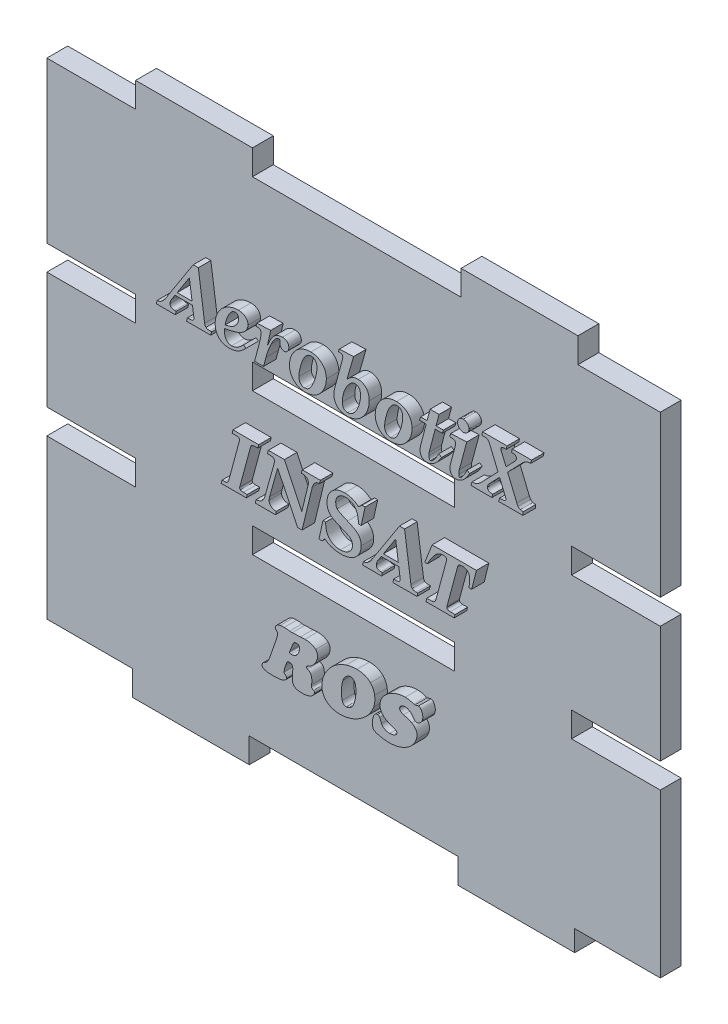
from build123d import *

# Parameters (mm, degrees)
BOSS_EXTRUDE1_DEPTH = 5
SKETCH2_W           = 46.467594828
SKETCH2_H           = 4
SKETCH2_W_2         = 20.266202586
SKETCH2_H_2         = 3.750431867
SKETCH2_W_3         = 21.036443238
SKETCH2_H_3         = 4.986905628
SKETCH2_W_4         = 19.500011691
CUT_EXTRUDE1_DEPTH  = 5
SKETCH4_W           = 21.266190895
SKETCH4_H           = 6
SKETCH4_W_2         = 50
SKETCH4_W_3         = 19.733809105
CUT_EXTRUDE2_DEPTH  = 5
BOSS_EXTRUDE2_DEPTH = 3
BOSS_EXTRUDE3_DEPTH = 3
SKETCH7_W           = 21.266202586
SKETCH7_H           = 6
SKETCH7_W_2         = 48.467594828
CUT_EXTRUDE3_DEPTH  = 5
SKETCH8_W           = 147
SKETCH8_H           = 16.683674381
CUT_EXTRUDE4_DEPTH  = 104.395814483
SKETCH9_W           = 48.467594828
SKETCH9_H           = 6
SKETCH9_W_2         = 21.266202586
SKETCH9_W_3         = 20.500011691
SKETCH9_H_2         = 5
SKETCH9_W_4         = 50
SKETCH9_W_5         = 20.536443238
SKETCH9_H_3         = 5.986905628
CUT_EXTRUDE5_DEPTH  = 104.395814483
BOSS_EXTRUDE4_DEPTH = 3


with BuildPart() as part:
    # Sketch1 → Boss-Extrude1 (new body)
    with BuildSketch(Plane.XY):
        Polygon((-24, -72.549599747), (-73.5, -72.549599747), (-73.5, 72.549599747), (73.5, 72.549599747), (73.5, -72.549599747), (24, -72.549599747), (24, -67.549599747), (-24, -67.549599747), align=None)
    extrude(amount=BOSS_EXTRUDE1_DEPTH)

    # Sketch2 → Cut-Extrude1 (cut)
    with BuildSketch(Plane.XY.offset(5)):
        with Locations((0, -25.549599747)):
            Rectangle(SKETCH2_W, SKETCH2_H)
        with Locations((63.366898707, -25.424815681)):
            Rectangle(SKETCH2_W_2, SKETCH2_H_2)
        with Locations((-63.366898707, -25.549599747)):
            Rectangle(SKETCH2_W_2, SKETCH2_H)
        with Locations((-64.481778381, -70.056146933)):
            Rectangle(SKETCH2_W_3, SKETCH2_H_3)
        with Locations((63.749994155, -70.549599747)):
            Rectangle(SKETCH2_W_4, SKETCH2_H)
    extrude(amount=-CUT_EXTRUDE1_DEPTH, mode=Mode.SUBTRACT)

    # Sketch4 → Cut-Extrude2 (cut)
    with BuildSketch(Plane.XY.offset(5)):
        with Locations((-62.866904553, 52.865925366)):
            Rectangle(SKETCH4_W, SKETCH4_H)
        with Locations((0.766190895, 52.865925366)):
            Rectangle(SKETCH4_W_2, SKETCH4_H)
        with Locations((63.633095447, 52.865925366)):
            Rectangle(SKETCH4_W_3, SKETCH4_H)
    extrude(amount=-CUT_EXTRUDE2_DEPTH, mode=Mode.SUBTRACT)

    # Sketch5 → Boss-Extrude2 (add)
    # profile 1 of 10: a face of its own
    with BuildSketch(Plane.XY.offset(5)):
        with BuildLine():
            Line((-35.419100404, 27.506307747), (-34.202898883, 27.506307747))
            Line((-34.202898883, 27.506307747), (-32.685781521, 16.728505398))
            add(Edge.make_bspline(
                [(-32.685781521, 16.728505398), (-32.673405071, 16.652554514), (-32.650233388, 16.510356238), (-32.578125911, 16.320938758), (-32.490671562, 16.161576338), (-32.405573267, 16.087116675), (-32.364804625, 16.051444758)],
                knots=[0, 0, 0, 0, 1.19913992, 2.245077621, 3.159256928, 4, 4, 4, 4], degree=3))
            add(Edge.make_bspline(
                [(-32.364804625, 16.051444758), (-32.301673643, 16.011449416), (-32.171351501, 15.928886491), (-31.944527036, 15.847941608), (-31.689727732, 15.800696005), (-31.510762979, 15.794106402), (-31.416919728, 15.790651029)],
                knots=[0, 0, 0, 0, 0.896077561, 1.849785075, 2.872497767, 4, 4, 4, 4], degree=3))
            Line((-31.416919728, 15.790651029), (-31.025729135, 15.790651029))
            Line((-31.025729135, 15.790651029), (-31.238877856, 14.988208788))
            Line((-31.238877856, 14.988208788), (-37.018969622, 14.988208788))
            Line((-37.018969622, 14.988208788), (-36.823374326, 15.790651029))
            Line((-36.823374326, 15.790651029), (-36.40209215, 15.790651029))
            add(Edge.make_bspline(
                [(-36.40209215, 15.790651029), (-36.299229308, 15.792308471), (-36.111352725, 15.79533575), (-35.85502699, 15.82256042), (-35.652166639, 15.873744224), (-35.494151088, 15.942575461), (-35.382218879, 16.041722429), (-35.304593731, 16.161255127), (-35.258638502, 16.303196111), (-35.253679416, 16.404674421), (-35.25108906, 16.457681142)],
                knots=[0, 0, 0, 0, 1.627737526, 2.973024647, 4.067005024, 4.930797178, 5.671134996, 6.397517551, 7.162950778, 8, 8, 8, 8], degree=3))
            add(Edge.make_bspline(
                [(-35.25108906, 16.457681142), (-35.251760256, 16.500400492), (-35.253188381, 16.591295926), (-35.268205865, 16.68097435), (-35.27616538, 16.728505398)],
                knots=[0, 0, 0, 0, 0.939966914, 2, 2, 2, 2], degree=3))
            Line((-35.27616538, 16.728505398), (-35.594634645, 19.000419993))
            Line((-35.594634645, 19.000419993), (-39.792410617, 19.000419993))
            Line((-39.792410617, 19.000419993), (-40.639990234, 17.686420824))
            add(Edge.make_bspline(
                [(-40.639990234, 17.686420824), (-40.693381063, 17.597372391), (-40.794816214, 17.42819275), (-40.902688809, 17.167230218), (-40.973870365, 16.918663683), (-40.983774863, 16.75484364), (-40.988551083, 16.675845126)],
                knots=[0, 0, 0, 0, 1.14988981, 2.184630764, 3.124579206, 4, 4, 4, 4], degree=3))
            add(Edge.make_bspline(
                [(-40.988551083, 16.675845126), (-40.985701949, 16.609350324), (-40.980261784, 16.482384467), (-40.92433624, 16.304226375), (-40.839397118, 16.14702955), (-40.714261072, 16.016284616), (-40.554782262, 15.910996091), (-40.357282045, 15.840151427), (-40.125180146, 15.798348865), (-39.958948628, 15.793331384), (-39.870147209, 15.790651029)],
                knots=[0, 0, 0, 0, 0.981158877, 1.87343483, 2.737388378, 3.603818457, 4.523378636, 5.541286218, 6.686547096, 8, 8, 8, 8], degree=3))
            Line((-39.870147209, 15.790651029), (-39.524093993, 15.790651029))
            Line((-39.524093993, 15.790651029), (-39.717181657, 14.988208788))
            Line((-39.717181657, 14.988208788), (-44.255995583, 14.988208788))
            Line((-44.255995583, 14.988208788), (-44.060400286, 15.790651029))
            add(Edge.make_bspline(
                [(-44.060400286, 15.790651029), (-43.968103762, 15.798341517), (-43.791031058, 15.813095868), (-43.543428183, 15.871124753), (-43.323192144, 15.952019113), (-43.198263274, 16.032446395), (-43.137591709, 16.071505814)],
                knots=[0, 0, 0, 0, 1.136170696, 2.179765923, 3.116005366, 4, 4, 4, 4], degree=3))
            add(Edge.make_bspline(
                [(-43.137591709, 16.071505814), (-43.033983293, 16.148100807), (-42.834210464, 16.295787636), (-42.570370308, 16.542430626), (-42.340349376, 16.791240346), (-42.216975106, 16.971864661), (-42.157107596, 17.059512823)],
                knots=[0, 0, 0, 0, 1.103396204, 2.127516181, 3.091375012, 4, 4, 4, 4], degree=3))
            Line((-42.157107596, 17.059512823), (-35.419100404, 27.506307747))
        make_face()
        Polygon((-36.346924245, 24.341676159), (-39.273330793, 19.802862234), (-35.707478085, 19.802862234), align=None, mode=Mode.SUBTRACT)
    # profile 2 of 10: a face of its own
    with BuildSketch(Plane.XY.offset(5)):
        with BuildLine():
            add(Edge.make_bspline(
                [(-27.886173868, 18.037489304), (-27.895707229, 17.926383304), (-27.9130369, 17.724415683), (-27.918722752, 17.521796918), (-27.921280716, 17.430642359)],
                knots=[0, 0, 0, 0, 1.10023577, 2, 2, 2, 2], degree=3))
            add(Edge.make_bspline(
                [(-27.921280716, 17.430642359), (-27.920011703, 17.347821511), (-27.917545567, 17.186871659), (-27.893492478, 16.953376865), (-27.86044463, 16.733099148), (-27.807087625, 16.528871239), (-27.742017056, 16.337992493), (-27.662187055, 16.163303464), (-27.568570931, 16.001813744), (-27.458608052, 15.858177947), (-27.337062158, 15.728448704), (-27.205382702, 15.61589213), (-27.062261371, 15.522263535), (-26.911529627, 15.443662555), (-26.749807538, 15.383097773), (-26.577928004, 15.341714605), (-26.396837959, 15.311822835), (-26.272224041, 15.310077332), (-26.208568058, 15.309185685)],
                knots=[0, 0, 0, 0, 1.289432652, 2.505818284, 3.653007062, 4.754983369, 5.788384422, 6.790393566, 7.741553273, 8.68932139, 9.601087962, 10.506231557, 11.380030586, 12.259243778, 13.149091262, 14.061601072, 15.009816144, 16, 16, 16, 16], degree=3))
            add(Edge.make_bspline(
                [(-26.208568058, 15.309185685), (-26.099648625, 15.31314729), (-25.880178298, 15.32112984), (-25.554048536, 15.383201333), (-25.231601465, 15.485753535), (-24.966002399, 15.602374875), (-24.750544116, 15.721160248), (-24.579968867, 15.833348162), (-24.398566498, 15.962847393), (-24.213092665, 16.117888552), (-24.012272282, 16.285343146), (-23.805720752, 16.476218079), (-23.589717678, 16.686691457), (-23.446362564, 16.836708432), (-23.372436263, 16.914070167)],
                knots=[0, 0, 0, 0, 1.166796897, 2.351070779, 3.543886222, 4.787299899, 5.452940811, 6.178517052, 6.974153343, 7.840205449, 8.768169163, 9.776339071, 10.853288003, 12, 12, 12, 12], degree=3))
            Line((-23.372436263, 16.914070167), (-22.785650374, 16.48024983))
            add(Edge.make_bspline(
                [(-22.785650374, 16.48024983), (-22.94874573, 16.312290363), (-23.261758152, 15.989942746), (-23.751111296, 15.564582854), (-24.239931442, 15.221109309), (-24.726848424, 14.94799455), (-25.22491629, 14.751235271), (-25.735021741, 14.610065607), (-26.26399868, 14.521537761), (-26.623655684, 14.511709502), (-26.805384475, 14.506743444)],
                knots=[0, 0, 0, 0, 1.215276831, 2.332357904, 3.360611622, 4.312459549, 5.223963669, 6.133719937, 7.056999267, 8, 8, 8, 8], degree=3))
            add(Edge.make_bspline(
                [(-26.805384475, 14.506743444), (-26.932554463, 14.509729237), (-27.180943523, 14.515561102), (-27.542811092, 14.558125007), (-27.883989731, 14.630365497), (-28.203598641, 14.734124254), (-28.504125462, 14.86339076), (-28.781386452, 15.026068638), (-29.039572202, 15.21487832), (-29.274705466, 15.433190425), (-29.485998368, 15.676882306), (-29.668851244, 15.942920011), (-29.823768156, 16.229525562), (-29.948437916, 16.537845935), (-30.049139312, 16.865593134), (-30.11938294, 17.214966584), (-30.15858673, 17.584376334), (-30.164891298, 17.837623151), (-30.16811899, 17.967275608)],
                knots=[0, 0, 0, 0, 1.117224344, 2.182168208, 3.196286246, 4.176432022, 5.130220092, 6.064899333, 6.99474726, 7.935437917, 8.877847255, 9.823114117, 10.766238647, 11.734591352, 12.740565232, 13.774750075, 14.860759149, 16, 16, 16, 16], degree=3))
            add(Edge.make_bspline(
                [(-30.16811899, 17.967275608), (-30.165528835, 18.085218808), (-30.160355692, 18.320778881), (-30.124153883, 18.671778312), (-30.066552315, 19.018537815), (-29.986436111, 19.361526803), (-29.879989634, 19.700278742), (-29.752283464, 20.036235228), (-29.601795367, 20.36849691), (-29.426181368, 20.692739334), (-29.231449107, 21.007811661), (-29.019314472, 21.308137923), (-28.789178196, 21.590745972), (-28.543733829, 21.85707465), (-28.279668372, 22.105777785), (-27.998205605, 22.337073364), (-27.699378442, 22.549791727), (-27.386430909, 22.745371132), (-27.061418477, 22.920433724), (-26.727808446, 23.073031491), (-26.389182043, 23.204637169), (-26.043582475, 23.309644156), (-25.692090915, 23.393623464), (-25.333149013, 23.449867184), (-24.968882018, 23.486488964), (-24.72413775, 23.49155255), (-24.601175944, 23.494096542)],
                knots=[0, 0, 0, 0, 0.976132897, 1.949565016, 2.917498797, 3.8841212, 4.86228702, 5.85425309, 6.857423291, 7.878939345, 8.904197228, 9.921604898, 10.920016122, 11.918786852, 12.917222047, 13.920010452, 14.931780295, 15.951162056, 16.972678109, 17.985015512, 18.985916662, 19.97730351, 20.972449275, 21.974521419, 22.982380637, 24, 24, 24, 24], degree=3))
            add(Edge.make_bspline(
                [(-24.601175944, 23.494096542), (-24.512489003, 23.493181952), (-24.339664164, 23.491399684), (-24.089165275, 23.462350487), (-23.853864092, 23.419442472), (-23.63267558, 23.364237393), (-23.427617536, 23.28448247), (-23.237549804, 23.190131903), (-23.062185389, 23.078953888), (-22.904824997, 22.95103979), (-22.764223138, 22.810216924), (-22.64094009, 22.660219774), (-22.537186324, 22.500196731), (-22.450691535, 22.331821397), (-22.386583071, 22.152687449), (-22.33763933, 21.965795808), (-22.310388335, 21.768808916), (-22.306281101, 21.634347905), (-22.304185029, 21.565727532)],
                knots=[0, 0, 0, 0, 1.259995388, 2.455361496, 3.578696781, 4.659435567, 5.689954299, 6.699574018, 7.671939146, 8.635040316, 9.576046008, 10.496497782, 11.389625257, 12.282357455, 13.180764858, 14.088552095, 15.024518193, 16, 16, 16, 16], degree=3))
            add(Edge.make_bspline(
                [(-22.304185029, 21.565727532), (-22.310927572, 21.448943712), (-22.324570465, 21.212642756), (-22.423807219, 20.8592328), (-22.583476677, 20.507382333), (-22.767131686, 20.221092944), (-22.942307023, 19.994120385), (-23.099767981, 19.828453422), (-23.275843296, 19.667706223), (-23.471205261, 19.512923309), (-23.686321433, 19.363618869), (-23.921826839, 19.222310423), (-24.175916534, 19.08376905), (-24.451596194, 18.949724127), (-24.755657245, 18.820106296), (-25.09481628, 18.699355634), (-25.468949431, 18.57794265), (-25.881113829, 18.464055279), (-26.330149251, 18.351403879), (-26.815782936, 18.241195879), (-27.338580162, 18.136252613), (-27.699655765, 18.071129473), (-27.886173868, 18.037489304)],
                knots=[0, 0, 0, 0, 0.981040538, 1.985042246, 3.063868762, 4.219941206, 4.835652052, 5.471990201, 6.1384988, 6.838682374, 7.565783226, 8.338293673, 9.146449843, 9.998160207, 10.914419236, 11.923645492, 13.023685264, 14.22061834, 15.517623204, 16.915519757, 18.406673293, 20, 20, 20, 20], degree=3))
        make_face()
        with BuildLine():
            add(Edge.make_bspline(
                [(-27.77583806, 18.839931545), (-27.651054151, 18.864760566), (-27.408744176, 18.91297447), (-27.060635672, 19.000819668), (-26.737786832, 19.097788139), (-26.442281074, 19.207906651), (-26.172953115, 19.327754231), (-25.930136583, 19.458465422), (-25.712956799, 19.60055438), (-25.584078284, 19.708028201), (-25.521476889, 19.76023249)],
                knots=[0, 0, 0, 0, 1.239394995, 2.406702698, 3.496407519, 4.521996393, 5.477033907, 6.366152797, 7.206375752, 8, 8, 8, 8], degree=3))
            add(Edge.make_bspline(
                [(-25.521476889, 19.76023249), (-25.443925798, 19.833194781), (-25.293352254, 19.974858691), (-25.097109015, 20.206430087), (-24.926520452, 20.44095802), (-24.792095301, 20.686593636), (-24.681024773, 20.935390885), (-24.60666018, 21.193696999), (-24.55942672, 21.458664715), (-24.553838627, 21.638248158), (-24.551023304, 21.728723612)],
                knots=[0, 0, 0, 0, 1.128248, 2.190611334, 3.213795633, 4.197837831, 5.154554236, 6.096956526, 7.041232754, 8, 8, 8, 8], degree=3))
            add(Edge.make_bspline(
                [(-24.551023304, 21.728723612), (-24.554173548, 21.799925331), (-24.56019508, 21.936023797), (-24.598158133, 22.128868128), (-24.670228016, 22.296488827), (-24.768324237, 22.43737766), (-24.885970925, 22.551014555), (-25.020350368, 22.634987344), (-25.171289661, 22.683922865), (-25.277053175, 22.689046092), (-25.330896857, 22.691654301)],
                knots=[0, 0, 0, 0, 1.229858297, 2.350811606, 3.372297497, 4.357237952, 5.296382159, 6.177623391, 7.072237075, 8, 8, 8, 8], degree=3))
            add(Edge.make_bspline(
                [(-25.330896857, 22.691654301), (-25.386239024, 22.689028255), (-25.49717543, 22.683764201), (-25.662079563, 22.647416686), (-25.824134732, 22.586519928), (-25.982202552, 22.499439068), (-26.139074107, 22.391766362), (-26.289669068, 22.255517066), (-26.440270206, 22.098997529), (-26.532289346, 21.98040335), (-26.579697594, 21.919303644)],
                knots=[0, 0, 0, 0, 0.871505153, 1.746979833, 2.646963753, 3.5895699, 4.583037995, 5.637129877, 6.782649637, 8, 8, 8, 8], degree=3))
            add(Edge.make_bspline(
                [(-26.579697594, 21.919303644), (-26.649889815, 21.822603614), (-26.792543171, 21.626077795), (-26.979682378, 21.304298885), (-27.152398351, 20.958114949), (-27.310514664, 20.585414781), (-27.453362564, 20.18704093), (-27.577737985, 19.761274695), (-27.689195531, 19.310609359), (-27.746540009, 18.999090596), (-27.77583806, 18.839931545)],
                knots=[0, 0, 0, 0, 0.859700307, 1.747189812, 2.675574047, 3.643444113, 4.659797057, 5.720274367, 6.835258056, 8, 8, 8, 8], degree=3))
        make_face(mode=Mode.SUBTRACT)
    # profile 3 of 10: a face of its own
    with BuildSketch(Plane.XY.offset(5)):
        with BuildLine():
            Line((-20.157652035, 23.012631198), (-16.852593055, 23.173119646))
            Line((-16.852593055, 23.173119646), (-17.667573456, 19.542068506))
            add(Edge.make_bspline(
                [(-17.667573456, 19.542068506), (-17.601748063, 19.704671738), (-17.475121755, 20.017466638), (-17.27578736, 20.461455418), (-17.083565374, 20.865799718), (-16.895459676, 21.229610502), (-16.714408068, 21.554403207), (-16.53286746, 21.835477053), (-16.359416718, 22.078724825), (-16.235958582, 22.219415155), (-16.178040046, 22.285417917)],
                knots=[0, 0, 0, 0, 1.342415811, 2.582364531, 3.724027319, 4.768342843, 5.716538923, 6.568290603, 7.328334982, 8, 8, 8, 8], degree=3))
            add(Edge.make_bspline(
                [(-16.178040046, 22.285417917), (-16.099920096, 22.356349473), (-15.945994655, 22.496111095), (-15.696290013, 22.675949243), (-15.439348012, 22.830669457), (-15.173394976, 22.957035803), (-14.89771744, 23.051389068), (-14.616366392, 23.123516428), (-14.325196363, 23.163347671), (-14.128579587, 23.169834349), (-14.02899942, 23.173119646)],
                knots=[0, 0, 0, 0, 1.061480286, 2.091512078, 3.091550035, 4.07772142, 5.049026958, 6.020441829, 6.997416514, 8, 8, 8, 8], degree=3))
            add(Edge.make_bspline(
                [(-14.02899942, 23.173119646), (-13.918976127, 23.169835561), (-13.708765394, 23.163560981), (-13.412008699, 23.087086291), (-13.147080505, 22.970396362), (-12.923211813, 22.79987832), (-12.741869257, 22.594051891), (-12.60631605, 22.357004233), (-12.527341013, 22.088901119), (-12.518782312, 21.90059686), (-12.51438969, 21.803952572)],
                knots=[0, 0, 0, 0, 1.147788183, 2.19296649, 3.182608362, 4.156372597, 5.110238538, 6.033991048, 6.990975904, 8, 8, 8, 8], degree=3))
            add(Edge.make_bspline(
                [(-12.51438969, 21.803952572), (-12.518913291, 21.710828768), (-12.52770275, 21.529887091), (-12.590530151, 21.26970768), (-12.700112364, 21.034573842), (-12.851162756, 20.831340244), (-13.0256154, 20.660056279), (-13.222683547, 20.537279758), (-13.434047568, 20.459105645), (-13.58114675, 20.449607897), (-13.655362251, 20.444816027)],
                knots=[0, 0, 0, 0, 1.136176863, 2.207617579, 3.2436959, 4.280326622, 5.283326792, 6.209045702, 7.096415297, 8, 8, 8, 8], degree=3))
            add(Edge.make_bspline(
                [(-13.655362251, 20.444816027), (-13.719347532, 20.4477576), (-13.844848325, 20.453527203), (-14.02402116, 20.512178969), (-14.188648501, 20.603891747), (-14.331588912, 20.732280131), (-14.452079442, 20.883353948), (-14.539644752, 21.055445173), (-14.590381759, 21.243559376), (-14.597247977, 21.374010341), (-14.600739517, 21.440345932)],
                knots=[0, 0, 0, 0, 1.002452448, 1.966211214, 2.930685731, 3.945113291, 4.964629985, 5.951472357, 6.95830366, 8, 8, 8, 8], degree=3))
            add(Edge.make_bspline(
                [(-14.600739517, 21.440345932), (-14.600739517, 21.523097788), (-14.600739517, 21.698632028), (-14.600739517, 21.874166268), (-14.600739517, 21.966948652)],
                knots=[0, 0, 0, 0, 0.942857143, 2, 2, 2, 2], degree=3))
            add(Edge.make_bspline(
                [(-14.600739517, 21.966948652), (-14.600739517, 21.996204359), (-14.600739517, 22.047192877), (-14.600739517, 22.098181394), (-14.600739517, 22.119914205)],
                knots=[0, 0, 0, 0, 1.147540984, 2, 2, 2, 2], degree=3))
            add(Edge.make_bspline(
                [(-14.600739517, 22.119914205), (-14.604633562, 22.1519835), (-14.612642305, 22.217939263), (-14.679001853, 22.296541055), (-14.764195871, 22.360151549), (-14.835291933, 22.36712148), (-14.871563773, 22.370677405)],
                knots=[0, 0, 0, 0, 0.936663483, 1.926402031, 2.942090323, 4, 4, 4, 4], degree=3))
            add(Edge.make_bspline(
                [(-14.871563773, 22.370677405), (-14.931504905, 22.365943879), (-15.060068055, 22.355791301), (-15.255534076, 22.276791212), (-15.465704327, 22.16077068), (-15.648596751, 22.029421117), (-15.801951387, 21.893548907), (-15.923453786, 21.759998994), (-16.049300519, 21.600376033), (-16.179241147, 21.41411276), (-16.314026074, 21.201647533), (-16.451725941, 20.961779394), (-16.595216199, 20.696522246), (-16.686980897, 20.507877872), (-16.734734351, 20.409709179)],
                knots=[0, 0, 0, 0, 0.762448154, 1.635316719, 2.655604188, 3.82345821, 4.494964078, 5.263934069, 6.120792562, 7.084326867, 8.157156896, 9.326613346, 10.608795653, 12, 12, 12, 12], degree=3))
            add(Edge.make_bspline(
                [(-16.734734351, 20.409709179), (-16.864701101, 20.130955128), (-17.122794946, 19.577392739), (-17.456200153, 18.729774204), (-17.753182675, 17.879796207), (-17.9153567, 17.305317667), (-17.996073248, 17.019390711)],
                knots=[0, 0, 0, 0, 1.018667967, 2.022916876, 3.015974802, 4, 4, 4, 4], degree=3))
            Line((-17.996073248, 17.019390711), (-18.572828609, 14.82772034))
            Line((-18.572828609, 14.82772034), (-20.724376868, 14.82772034))
            Line((-20.724376868, 14.82772034), (-19.520713506, 19.374057161))
            add(Edge.make_bspline(
                [(-19.520713506, 19.374057161), (-19.493580854, 19.477608497), (-19.440959388, 19.678437482), (-19.370790667, 19.971903082), (-19.310189581, 20.248554132), (-19.259276323, 20.509158917), (-19.221231441, 20.753420612), (-19.197491051, 20.981202068), (-19.177093123, 21.191730281), (-19.175450093, 21.327457088), (-19.17466029, 21.392700924)],
                knots=[0, 0, 0, 0, 1.251111759, 2.42642455, 3.526355183, 4.561004516, 5.52956969, 6.414239298, 7.237725304, 8, 8, 8, 8], degree=3))
            add(Edge.make_bspline(
                [(-19.17466029, 21.392700924), (-19.177226465, 21.472330289), (-19.18194478, 21.618741303), (-19.223060797, 21.819292633), (-19.293681875, 21.980030451), (-19.404292514, 22.104381656), (-19.566674069, 22.185672599), (-19.782909449, 22.235943489), (-20.059794549, 22.267239073), (-20.265381395, 22.267642735), (-20.378323651, 22.267864493)],
                knots=[0, 0, 0, 0, 1.083723772, 1.99259529, 2.77186058, 3.448857453, 4.213006247, 5.201596234, 6.462654398, 8, 8, 8, 8], degree=3))
            Line((-20.378323651, 22.267864493), (-20.157652035, 23.012631198))
        make_face()
    # profile 4 of 10: a face of its own
    with BuildSketch(Plane.XY.offset(5)):
        with BuildLine():
            add(Edge.make_bspline(
                [(-7.245854852, 23.494096542), (-7.11199244, 23.490367502), (-6.849264124, 23.483048609), (-6.464317363, 23.436141573), (-6.098403389, 23.352505178), (-5.751119828, 23.237553825), (-5.423106893, 23.089043699), (-5.115145808, 22.906676354), (-4.82543874, 22.693115459), (-4.558734629, 22.447239978), (-4.315274667, 22.178050659), (-4.104984216, 21.886218878), (-3.925052753, 21.578456884), (-3.778562194, 21.252410652), (-3.666092098, 20.908386288), (-3.586592367, 20.546301423), (-3.534000159, 20.168013946), (-3.529381642, 19.909199036), (-3.527036592, 19.777785914)],
                knots=[0, 0, 0, 0, 1.089394915, 2.138127388, 3.149669057, 4.13915119, 5.110248765, 6.073860701, 7.046600715, 8.033577915, 9.02102381, 9.995237277, 10.955409836, 11.917508038, 12.898395413, 13.895168921, 14.931273223, 16, 16, 16, 16], degree=3))
            add(Edge.make_bspline(
                [(-3.527036592, 19.777785914), (-3.531497429, 19.609571272), (-3.540319873, 19.276883898), (-3.607008743, 18.784697797), (-3.71812575, 18.306584271), (-3.871103173, 17.840118991), (-4.070479616, 17.388179821), (-4.312486234, 16.948912986), (-4.600622264, 16.525016245), (-4.924965705, 16.116797342), (-5.285144235, 15.739631346), (-5.677748285, 15.407243787), (-6.102645578, 15.132006255), (-6.550649171, 14.90005783), (-7.029158546, 14.725704474), (-7.533546051, 14.596264371), (-8.066909725, 14.520760749), (-8.43172854, 14.51147344), (-8.617529558, 14.506743444)],
                knots=[0, 0, 0, 0, 0.989049682, 1.956098104, 2.91480212, 3.872371231, 4.838669732, 5.815550796, 6.817646548, 7.849444325, 8.878533582, 9.87990566, 10.86702334, 11.849737097, 12.840483336, 13.855088396, 14.907603603, 16, 16, 16, 16], degree=3))
            add(Edge.make_bspline(
                [(-8.617529558, 14.506743444), (-8.753889665, 14.510481443), (-9.020767621, 14.51779729), (-9.410857765, 14.564208577), (-9.779463908, 14.649133502), (-10.130267128, 14.760067274), (-10.460244886, 14.909432221), (-10.769631385, 15.0911451), (-11.06109063, 15.302682644), (-11.327414493, 15.547749928), (-11.566888496, 15.818590877), (-11.780547378, 16.106916524), (-11.955227903, 16.418350221), (-12.102027647, 16.745174981), (-12.215668732, 17.091441913), (-12.293940169, 17.456320668), (-12.347124862, 17.838664216), (-12.35161465, 18.099993144), (-12.353901242, 18.2330846)],
                knots=[0, 0, 0, 0, 1.103904577, 2.160513098, 3.173295853, 4.161853674, 5.133973299, 6.098314802, 7.06189642, 8.043646214, 9.021353994, 9.984935612, 10.942512063, 11.905689748, 12.881381971, 13.886086298, 14.923410984, 16, 16, 16, 16], degree=3))
            add(Edge.make_bspline(
                [(-12.353901242, 18.2330846), (-12.352121009, 18.348505741), (-12.348566249, 18.578978033), (-12.31535017, 18.921727703), (-12.259014662, 19.259725628), (-12.184790003, 19.593527416), (-12.08601612, 19.923387296), (-11.965945375, 20.24822114), (-11.824427302, 20.56896736), (-11.662827122, 20.88217862), (-11.482408391, 21.185074289), (-11.287831193, 21.472665818), (-11.078924244, 21.742855231), (-10.855045969, 21.993155103), (-10.619908991, 22.228159098), (-10.366604128, 22.441260528), (-10.10230989, 22.639834736), (-9.822345843, 22.817671984), (-9.533169763, 22.978038065), (-9.233368946, 23.116966226), (-8.92361572, 23.232095929), (-8.605173294, 23.326951854), (-8.278008196, 23.403565284), (-7.941708349, 23.454492774), (-7.596819211, 23.489281794), (-7.363802147, 23.492478468), (-7.245854852, 23.494096542)],
                knots=[0, 0, 0, 0, 1.017839218, 2.032415693, 3.033563478, 4.038747892, 5.046443617, 6.068120532, 7.0914188, 8.136684174, 9.174748653, 10.199214827, 11.197589871, 12.184548281, 13.159426911, 14.127030226, 15.10168581, 16.073129448, 17.049874089, 18.016381383, 18.984546279, 19.961875056, 20.945495923, 21.945475744, 22.96005222, 24, 24, 24, 24], degree=3))
        make_face()
        with BuildLine():
            add(Edge.make_bspline(
                [(-7.135519044, 22.691654301), (-7.192468368, 22.689579111), (-7.305357779, 22.685465508), (-7.471900745, 22.657013694), (-7.633895218, 22.611145939), (-7.792776805, 22.549017271), (-7.945841761, 22.464980034), (-8.094291824, 22.364075222), (-8.239048856, 22.245183282), (-8.328308199, 22.154229811), (-8.374289253, 22.107376045)],
                knots=[0, 0, 0, 0, 0.969134893, 1.921095084, 2.866975808, 3.831294834, 4.818023575, 5.83216807, 6.883263157, 8, 8, 8, 8], degree=3))
            add(Edge.make_bspline(
                [(-8.374289253, 22.107376045), (-8.437228996, 22.036390891), (-8.566408082, 21.890699203), (-8.744480945, 21.648473763), (-8.911969105, 21.37846648), (-9.072833775, 21.082483023), (-9.222453015, 20.75758559), (-9.364536936, 20.406645647), (-9.500840293, 20.029881895), (-9.622548608, 19.633282586), (-9.731978952, 19.23353601), (-9.834230096, 18.848178897), (-9.916767039, 18.481600662), (-9.983479313, 18.135946567), (-10.041428696, 17.811298426), (-10.07775035, 17.506477077), (-10.10231115, 17.222075115), (-10.105519748, 17.039497763), (-10.107062967, 16.951684647)],
                knots=[0, 0, 0, 0, 0.823439471, 1.690047563, 2.606322013, 3.580607108, 4.61318934, 5.71027936, 6.867356374, 8.090925028, 9.311217377, 10.466015871, 11.552394314, 12.572969367, 13.522751413, 14.414878089, 15.237613574, 16, 16, 16, 16], degree=3))
            add(Edge.make_bspline(
                [(-10.107062967, 16.951684647), (-10.102288743, 16.826818458), (-10.09323187, 16.589942883), (-10.024934049, 16.256128788), (-9.903500568, 15.96820844), (-9.733851338, 15.728360561), (-9.522678571, 15.54046596), (-9.2792792, 15.403745961), (-9.003459684, 15.324784737), (-8.810288596, 15.314505668), (-8.710311942, 15.309185685)],
                knots=[0, 0, 0, 0, 1.229766555, 2.332910639, 3.336357753, 4.286949671, 5.202658854, 6.098490275, 7.015864216, 8, 8, 8, 8], degree=3))
            add(Edge.make_bspline(
                [(-8.710311942, 15.309185685), (-8.612719089, 15.313422302), (-8.419101008, 15.321827485), (-8.14066158, 15.407198666), (-7.877654698, 15.537791905), (-7.726749034, 15.663618799), (-7.649583605, 15.727960229)],
                knots=[0, 0, 0, 0, 1.00092916, 1.985780483, 2.970031287, 4, 4, 4, 4], degree=3))
            add(Edge.make_bspline(
                [(-7.649583605, 15.727960229), (-7.592354572, 15.78452609), (-7.473327349, 15.902174021), (-7.311280923, 16.10966572), (-7.147841868, 16.345152006), (-6.988742811, 16.614167257), (-6.83078282, 16.912999395), (-6.675823199, 17.243295055), (-6.520144367, 17.603041406), (-6.372797028, 17.989245288), (-6.234544376, 18.38636726), (-6.11007748, 18.783021777), (-6.008445332, 19.174252382), (-5.92169593, 19.557770877), (-5.857290151, 19.934607624), (-5.808516581, 20.303362497), (-5.78048642, 20.665886702), (-5.776066564, 20.905340014), (-5.773874866, 21.024079019)],
                knots=[0, 0, 0, 0, 0.673936533, 1.401680043, 2.202502693, 3.076164793, 4.019675939, 5.035245033, 6.133843712, 7.305041502, 8.499506752, 9.658673353, 10.788929146, 11.887192562, 12.953954163, 13.99258966, 15.00457461, 16, 16, 16, 16], degree=3))
            add(Edge.make_bspline(
                [(-5.773874866, 21.024079019), (-5.778771882, 21.148069304), (-5.78809124, 21.384031365), (-5.855498925, 21.71856783), (-5.98163653, 22.007757235), (-6.149019682, 22.253671139), (-6.356241612, 22.448635168), (-6.591985266, 22.590343595), (-6.855449024, 22.677328643), (-7.040394871, 22.686788674), (-7.135519044, 22.691654301)],
                knots=[0, 0, 0, 0, 1.231316899, 2.343280966, 3.365659712, 4.344237098, 5.277955194, 6.167689091, 7.057577859, 8, 8, 8, 8], degree=3))
        make_face(mode=Mode.SUBTRACT)
    # profile 5 of 10: a face of its own
    with BuildSketch(Plane.XY.offset(5)):
        with BuildLine():
            Line((-0.42008054, 27.506307747), (3.000329512, 27.666796195))
            Line((3.000329512, 27.666796195), (1.410490822, 22.134959997))
            add(Edge.make_bspline(
                [(1.410490822, 22.134959997), (1.531531881, 22.257289474), (1.760651438, 22.488847888), (2.113360899, 22.787172862), (2.442565238, 23.030826665), (2.764777168, 23.20887427), (3.084509984, 23.337532925), (3.413386698, 23.427843189), (3.757313524, 23.484939426), (3.992292061, 23.491019517), (4.111210489, 23.494096542)],
                knots=[0, 0, 0, 0, 1.322855923, 2.504044202, 3.549525109, 4.467387315, 5.326888838, 6.194049248, 7.08604068, 8, 8, 8, 8], degree=3))
            add(Edge.make_bspline(
                [(4.111210489, 23.494096542), (4.205820151, 23.492005642), (4.391750768, 23.487896522), (4.663070615, 23.446184668), (4.922194575, 23.381135109), (5.167348693, 23.289076168), (5.398274978, 23.168399252), (5.617798092, 23.026329081), (5.82203534, 22.853338103), (6.010875, 22.655874136), (6.184735199, 22.437952088), (6.336412109, 22.198840284), (6.460202965, 21.938269716), (6.567232077, 21.662403812), (6.646788823, 21.365491118), (6.704422439, 21.050235633), (6.736036014, 20.715443967), (6.741452155, 20.486671144), (6.744224092, 20.369587067)],
                knots=[0, 0, 0, 0, 0.987402558, 1.94048222, 2.859366782, 3.773803727, 4.667888748, 5.575844247, 6.499072462, 7.45602215, 8.425354291, 9.406213713, 10.405697736, 11.433561012, 12.492428691, 13.610524944, 14.777086027, 16, 16, 16, 16], degree=3))
            add(Edge.make_bspline(
                [(6.744224092, 20.369587067), (6.741689595, 20.241612105), (6.736644344, 19.986861044), (6.699794538, 19.606772369), (6.643827385, 19.2311379), (6.559254872, 18.860585509), (6.454231148, 18.494580488), (6.326518558, 18.132284631), (6.172650463, 17.77610233), (5.997672139, 17.427499906), (5.806917961, 17.089253524), (5.594232391, 16.771601501), (5.37314233, 16.469300703), (5.132449898, 16.190270522), (4.879883397, 15.928560811), (4.610865611, 15.688316503), (4.329019928, 15.465392611), (4.031555179, 15.266187817), (3.723462496, 15.089061216), (3.409569422, 14.931681485), (3.087055034, 14.801826391), (2.759032342, 14.693142871), (2.423452579, 14.610770214), (2.081850403, 14.549843512), (1.733044526, 14.514617261), (1.498333672, 14.509376668), (1.380399238, 14.506743444)],
                knots=[0, 0, 0, 0, 1.045475324, 2.0811567, 3.117558393, 4.146484934, 5.1840336, 6.22734292, 7.282830669, 8.351820604, 9.413235321, 10.453141417, 11.473487256, 12.471299495, 13.461392372, 14.44315903, 15.415929083, 16.395222174, 17.365159166, 18.318092231, 19.261654981, 20.203287899, 21.139157286, 22.082324494, 23.036431545, 24, 24, 24, 24], degree=3))
            add(Edge.make_bspline(
                [(1.380399238, 14.506743444), (1.226230638, 14.510187221), (0.926913535, 14.516873287), (0.495150525, 14.594128004), (0.092057122, 14.705726977), (-0.275083293, 14.873098398), (-0.606617067, 15.081560055), (-0.898330698, 15.333233233), (-1.15152189, 15.624082571), (-1.361765122, 15.953204492), (-1.525979795, 16.312685313), (-1.648287857, 16.693541447), (-1.718772414, 17.095369105), (-1.728927143, 17.369356306), (-1.73407971, 17.508378951)],
                knots=[0, 0, 0, 0, 1.138369329, 2.210134934, 3.232952002, 4.223045741, 5.181351288, 6.119033575, 7.06075906, 8.022386025, 8.995617347, 9.974716274, 10.972359658, 12, 12, 12, 12], degree=3))
            add(Edge.make_bspline(
                [(-1.73407971, 17.508378951), (-1.732676586, 17.599539059), (-1.729917388, 17.778802581), (-1.707144696, 18.040110304), (-1.670320002, 18.289145764), (-1.632399616, 18.448132671), (-1.613713374, 18.526477544)],
                knots=[0, 0, 0, 0, 1.064116368, 2.092551801, 3.060056012, 4, 4, 4, 4], degree=3))
            Line((-1.613713374, 18.526477544), (0.372331173, 25.896408001))
            add(Edge.make_bspline(
                [(0.372331173, 25.896408001), (0.385080491, 25.958885475), (0.410242417, 26.08219038), (0.413402178, 26.20798804), (0.414960917, 26.270045169)],
                knots=[0, 0, 0, 0, 1.013381804, 2, 2, 2, 2], degree=3))
            add(Edge.make_bspline(
                [(0.414960917, 26.270045169), (0.413149286, 26.314497753), (0.409684281, 26.399519753), (0.380396378, 26.519930895), (0.325837545, 26.623190515), (0.250876401, 26.71073645), (0.152679758, 26.785143537), (0.022369307, 26.82920167), (-0.132712446, 26.860264574), (-0.246008032, 26.862919263), (-0.3072371, 26.864353954)],
                knots=[0, 0, 0, 0, 0.994651356, 1.902414648, 2.747855356, 3.584133382, 4.467455787, 5.468424682, 6.631844352, 8, 8, 8, 8], degree=3))
            Line((-0.3072371, 26.864353954), (-0.638244525, 26.864353954))
            Line((-0.638244525, 26.864353954), (-0.42008054, 27.506307747))
        make_face()
        with BuildLine():
            add(Edge.make_bspline(
                [(3.426626952, 22.210188957), (3.330673413, 22.204051207), (3.134897388, 22.191528228), (2.843794283, 22.096601796), (2.551873698, 21.947601727), (2.372157237, 21.808843394), (2.278131495, 21.736246508)],
                knots=[0, 0, 0, 0, 0.908036079, 1.852685125, 2.876547681, 4, 4, 4, 4], degree=3))
            add(Edge.make_bspline(
                [(2.278131495, 21.736246508), (2.211088075, 21.677970972), (2.074395567, 21.559155), (1.8843207, 21.356714936), (1.701147091, 21.132228286), (1.523001185, 20.88647853), (1.351927719, 20.616973805), (1.190309757, 20.323935765), (1.034880044, 20.008886497), (0.835159229, 19.565881078), (0.628167433, 18.993346838), (0.441354003, 18.297775294), (0.330714308, 17.600529147), (0.314956369, 17.135113133), (0.307132741, 16.904039639)],
                knots=[0, 0, 0, 0, 0.596523667, 1.216231451, 1.862692809, 2.542333416, 3.254338515, 4.006014917, 4.789636617, 5.614189887, 7.270034087, 8.873378258, 10.447669635, 12, 12, 12, 12], degree=3))
            add(Edge.make_bspline(
                [(0.307132741, 16.904039639), (0.3110424, 16.777502068), (0.318378569, 16.540064249), (0.382665045, 16.209384868), (0.489463077, 15.928675303), (0.642186575, 15.699412349), (0.833765828, 15.523690076), (1.055395185, 15.396850532), (1.307259476, 15.322891159), (1.484391782, 15.31385742), (1.575994534, 15.309185685)],
                knots=[0, 0, 0, 0, 1.314083108, 2.46577382, 3.483687874, 4.416127949, 5.30144739, 6.161296798, 7.049127306, 8, 8, 8, 8], degree=3))
            add(Edge.make_bspline(
                [(1.575994534, 15.309185685), (1.682038473, 15.314815298), (1.894654594, 15.326102568), (2.205983873, 15.424378401), (2.511617153, 15.571157793), (2.69502557, 15.712621761), (2.789688423, 15.785635765)],
                knots=[0, 0, 0, 0, 0.955018343, 1.914793967, 2.923759566, 4, 4, 4, 4], degree=3))
            add(Edge.make_bspline(
                [(2.789688423, 15.785635765), (2.855223422, 15.841232985), (2.988447086, 15.954254507), (3.170080506, 16.150788245), (3.3485381, 16.363393633), (3.520215738, 16.596972165), (3.678765216, 16.854765537), (3.836337713, 17.129845921), (3.979364247, 17.429927488), (4.168148914, 17.853312296), (4.36621711, 18.409128214), (4.532515804, 19.100215768), (4.640930561, 19.807791928), (4.652198025, 20.28643873), (4.657874265, 20.527567883)],
                knots=[0, 0, 0, 0, 0.589712795, 1.198805228, 1.834581128, 2.495939917, 3.187192206, 3.912047349, 4.671991357, 5.468768906, 7.095621522, 8.714870439, 10.345041678, 12, 12, 12, 12], degree=3))
            add(Edge.make_bspline(
                [(4.657874265, 20.527567883), (4.654996697, 20.664973973), (4.649644024, 20.920568215), (4.586662787, 21.274429935), (4.488017064, 21.572230442), (4.339464187, 21.810172994), (4.154073257, 21.991054577), (3.938225742, 22.119017064), (3.691883213, 22.197813255), (3.517514261, 22.205948551), (3.426626952, 22.210188957)],
                knots=[0, 0, 0, 0, 1.39225795, 2.589791446, 3.633020487, 4.555199895, 5.406683286, 6.235575067, 7.080318881, 8, 8, 8, 8], degree=3))
        make_face(mode=Mode.SUBTRACT)
    # profile 6 of 10: a face of its own
    with BuildSketch(Plane.XY.offset(5)):
        with BuildLine():
            add(Edge.make_bspline(
                [(13.296666515, 23.494096542), (13.430528928, 23.490367502), (13.693257243, 23.483048609), (14.078204004, 23.436141573), (14.444117978, 23.352505178), (14.79140154, 23.237553825), (15.119414475, 23.089043699), (15.427375559, 22.906676354), (15.717082628, 22.693115459), (15.983786739, 22.447239978), (16.227246701, 22.178050659), (16.437537152, 21.886218878), (16.617468615, 21.578456884), (16.763959174, 21.252410652), (16.87642927, 20.908386288), (16.955929001, 20.546301423), (17.008521208, 20.168013946), (17.013139726, 19.909199036), (17.015484776, 19.777785914)],
                knots=[0, 0, 0, 0, 1.089394915, 2.138127388, 3.149669057, 4.13915119, 5.110248765, 6.073860701, 7.046600715, 8.033577915, 9.02102381, 9.995237277, 10.955409836, 11.917508038, 12.898395413, 13.895168921, 14.931273223, 16, 16, 16, 16], degree=3))
            add(Edge.make_bspline(
                [(17.015484776, 19.777785914), (17.011023938, 19.609571272), (17.002201495, 19.276883898), (16.935512625, 18.784697797), (16.824395617, 18.306584271), (16.671418194, 17.840118991), (16.472041752, 17.388179821), (16.230035134, 16.948912986), (15.941899103, 16.525016245), (15.617555663, 16.116797342), (15.257377132, 15.739631346), (14.864773083, 15.407243787), (14.439875789, 15.132006255), (13.991872197, 14.90005783), (13.513362822, 14.725704474), (13.008975316, 14.596264371), (12.475611643, 14.520760749), (12.110792828, 14.51147344), (11.92499181, 14.506743444)],
                knots=[0, 0, 0, 0, 0.989049682, 1.956098104, 2.91480212, 3.872371231, 4.838669732, 5.815550796, 6.817646548, 7.849444325, 8.878533582, 9.87990566, 10.86702334, 11.849737097, 12.840483336, 13.855088396, 14.907603603, 16, 16, 16, 16], degree=3))
            add(Edge.make_bspline(
                [(11.92499181, 14.506743444), (11.788631703, 14.510481443), (11.521753746, 14.51779729), (11.131663602, 14.564208577), (10.76305746, 14.649133502), (10.412254239, 14.760067274), (10.082276482, 14.909432221), (9.772889982, 15.0911451), (9.481430738, 15.302682644), (9.215106874, 15.547749928), (8.975632872, 15.818590877), (8.761973989, 16.106916524), (8.587293464, 16.418350221), (8.44049372, 16.745174981), (8.326852636, 17.091441913), (8.248581199, 17.456320668), (8.195396506, 17.838664216), (8.190906717, 18.099993144), (8.188620126, 18.2330846)],
                knots=[0, 0, 0, 0, 1.103904577, 2.160513098, 3.173295853, 4.161853674, 5.133973299, 6.098314802, 7.06189642, 8.043646214, 9.021353994, 9.984935612, 10.942512063, 11.905689748, 12.881381971, 13.886086298, 14.923410984, 16, 16, 16, 16], degree=3))
            add(Edge.make_bspline(
                [(8.188620126, 18.2330846), (8.190400359, 18.348505741), (8.193955119, 18.578978033), (8.227171198, 18.921727703), (8.283506706, 19.259725628), (8.357731364, 19.593527416), (8.456505247, 19.923387296), (8.576575993, 20.24822114), (8.718094066, 20.56896736), (8.879694245, 20.88217862), (9.060112976, 21.185074289), (9.254690174, 21.472665818), (9.463597123, 21.742855231), (9.687475399, 21.993155103), (9.922612377, 22.228159098), (10.17591724, 22.441260528), (10.440211478, 22.639834736), (10.720175524, 22.817671984), (11.009351604, 22.978038065), (11.309152422, 23.116966226), (11.618905647, 23.232095929), (11.937348074, 23.326951854), (12.264513172, 23.403565284), (12.600813019, 23.454492774), (12.945702157, 23.489281794), (13.17871922, 23.492478468), (13.296666515, 23.494096542)],
                knots=[0, 0, 0, 0, 1.017839218, 2.032415693, 3.033563478, 4.038747892, 5.046443617, 6.068120532, 7.0914188, 8.136684174, 9.174748653, 10.199214827, 11.197589871, 12.184548281, 13.159426911, 14.127030226, 15.10168581, 16.073129448, 17.049874089, 18.016381383, 18.984546279, 19.961875056, 20.945495923, 21.945475744, 22.96005222, 24, 24, 24, 24], degree=3))
        make_face()
        with BuildLine():
            add(Edge.make_bspline(
                [(13.407002324, 22.691654301), (13.350052999, 22.689579111), (13.237163589, 22.685465508), (13.070620622, 22.657013694), (12.908626149, 22.611145939), (12.749744563, 22.549017271), (12.596679607, 22.464980034), (12.448229543, 22.364075222), (12.303472511, 22.245183282), (12.214213168, 22.154229811), (12.168232114, 22.107376045)],
                knots=[0, 0, 0, 0, 0.969134893, 1.921095084, 2.866975808, 3.831294834, 4.818023575, 5.83216807, 6.883263157, 8, 8, 8, 8], degree=3))
            add(Edge.make_bspline(
                [(12.168232114, 22.107376045), (12.105292372, 22.036390891), (11.976113286, 21.890699203), (11.798040423, 21.648473763), (11.630552262, 21.37846648), (11.469687592, 21.082483023), (11.320068353, 20.75758559), (11.177984431, 20.406645647), (11.041681074, 20.029881895), (10.91997276, 19.633282586), (10.810542416, 19.23353601), (10.708291271, 18.848178897), (10.625754329, 18.481600662), (10.559042054, 18.135946567), (10.501092672, 17.811298426), (10.464771018, 17.506477077), (10.440210217, 17.222075115), (10.43700162, 17.039497763), (10.4354584, 16.951684647)],
                knots=[0, 0, 0, 0, 0.823439471, 1.690047563, 2.606322013, 3.580607108, 4.61318934, 5.71027936, 6.867356374, 8.090925028, 9.311217377, 10.466015871, 11.552394314, 12.572969367, 13.522751413, 14.414878089, 15.237613574, 16, 16, 16, 16], degree=3))
            add(Edge.make_bspline(
                [(10.4354584, 16.951684647), (10.440232625, 16.826818458), (10.449289498, 16.589942883), (10.517587319, 16.256128788), (10.6390208, 15.96820844), (10.80867003, 15.728360561), (11.019842797, 15.54046596), (11.263242167, 15.403745961), (11.539061684, 15.324784737), (11.732232772, 15.314505668), (11.832209426, 15.309185685)],
                knots=[0, 0, 0, 0, 1.229766555, 2.332910639, 3.336357753, 4.286949671, 5.202658854, 6.098490275, 7.015864216, 8, 8, 8, 8], degree=3))
            add(Edge.make_bspline(
                [(11.832209426, 15.309185685), (11.929802279, 15.313422302), (12.12342036, 15.321827485), (12.401859787, 15.407198666), (12.664866669, 15.537791905), (12.815772334, 15.663618799), (12.892937763, 15.727960229)],
                knots=[0, 0, 0, 0, 1.00092916, 1.985780483, 2.970031287, 4, 4, 4, 4], degree=3))
            add(Edge.make_bspline(
                [(12.892937763, 15.727960229), (12.950166796, 15.78452609), (13.069194018, 15.902174021), (13.231240444, 16.10966572), (13.394679499, 16.345152006), (13.553778557, 16.614167257), (13.711738548, 16.912999395), (13.866698169, 17.243295055), (14.022377001, 17.603041406), (14.16972434, 17.989245288), (14.307976991, 18.38636726), (14.432443887, 18.783021777), (14.534076036, 19.174252382), (14.620825437, 19.557770877), (14.685231216, 19.934607624), (14.734004786, 20.303362497), (14.762034947, 20.665886702), (14.766454803, 20.905340014), (14.768646501, 21.024079019)],
                knots=[0, 0, 0, 0, 0.673936533, 1.401680043, 2.202502693, 3.076164793, 4.019675939, 5.035245033, 6.133843712, 7.305041502, 8.499506752, 9.658673353, 10.788929146, 11.887192562, 12.953954163, 13.99258966, 15.00457461, 16, 16, 16, 16], degree=3))
            add(Edge.make_bspline(
                [(14.768646501, 21.024079019), (14.763749486, 21.148069304), (14.754430127, 21.384031365), (14.687022443, 21.71856783), (14.560884838, 22.007757235), (14.393501686, 22.253671139), (14.186279756, 22.448635168), (13.950536101, 22.590343595), (13.687072344, 22.677328643), (13.502126497, 22.686788674), (13.407002324, 22.691654301)],
                knots=[0, 0, 0, 0, 1.231316899, 2.343280966, 3.365659712, 4.344237098, 5.277955194, 6.167689091, 7.057577859, 8, 8, 8, 8], degree=3))
        make_face(mode=Mode.SUBTRACT)
    # profile 7 of 10: a face of its own
    with BuildSketch(Plane.XY.offset(5)):
        with BuildLine():
            Line((21.333627085, 25.901423265), (23.482667711, 25.901423265))
            Line((23.482667711, 25.901423265), (22.76799259, 23.173119646))
            Line((22.76799259, 23.173119646), (24.528350256, 23.173119646))
            Line((24.528350256, 23.173119646), (24.265048896, 22.370677405))
            Line((24.265048896, 22.370677405), (22.557351502, 22.370677405))
            Line((22.557351502, 22.370677405), (21.112955468, 16.863917527))
            add(Edge.make_bspline(
                [(21.112955468, 16.863917527), (21.093526982, 16.742131455), (21.055354403, 16.502849381), (21.048577235, 16.260648668), (21.045249404, 16.14171951)],
                knots=[0, 0, 0, 0, 1.017928917, 2, 2, 2, 2], degree=3))
            add(Edge.make_bspline(
                [(21.045249404, 16.14171951), (21.047020958, 16.076503784), (21.050321383, 15.955006127), (21.065694319, 15.784915636), (21.098320216, 15.640999905), (21.141322402, 15.521191044), (21.200010399, 15.428765276), (21.265817011, 15.360929628), (21.342109949, 15.315346885), (21.398237702, 15.311244675), (21.426409469, 15.309185685)],
                knots=[0, 0, 0, 0, 1.560364919, 2.906978017, 4.075660724, 5.081730688, 5.935699526, 6.67071915, 7.332804384, 8, 8, 8, 8], degree=3))
            add(Edge.make_bspline(
                [(21.426409469, 15.309185685), (21.455814471, 15.311570071), (21.518240647, 15.316632072), (21.613688616, 15.345121322), (21.711987003, 15.394942797), (21.816081824, 15.461366586), (21.925040025, 15.546271373), (22.038806023, 15.650462975), (22.155575333, 15.773894766), (22.27943076, 15.914572383), (22.405782686, 16.076272053), (22.542616977, 16.252959445), (22.678848371, 16.452186914), (22.822856599, 16.66802692), (22.969667045, 16.903712944), (23.123398457, 17.157404141), (23.280628998, 17.430395101), (23.385942467, 17.619418381), (23.440037967, 17.716512408)],
                knots=[0, 0, 0, 0, 0.439037052, 0.93206604, 1.472727101, 2.077782408, 2.770785266, 3.529481609, 4.375667434, 5.303036371, 6.3229313, 7.434637332, 8.634306317, 9.920149823, 11.303294959, 12.773798579, 14.34282377, 16, 16, 16, 16], degree=3))
            Line((23.440037967, 17.716512408), (24.076976496, 17.240062327))
            add(Edge.make_bspline(
                [(24.076976496, 17.240062327), (24.007616744, 17.125843554), (23.871947499, 16.902429045), (23.658918647, 16.584326355), (23.443223592, 16.288963901), (23.221893952, 16.01961378), (23.00266422, 15.768726687), (22.775688275, 15.546890326), (22.550006901, 15.34358391), (22.319401127, 15.166397942), (22.089387072, 15.011514802), (21.86204218, 14.876612338), (21.636966219, 14.764659995), (21.414761539, 14.669917073), (21.194023891, 14.597455333), (20.976261058, 14.543962855), (20.760295145, 14.51268791), (20.61737678, 14.508719137), (20.546230636, 14.506743444)],
                knots=[0, 0, 0, 0, 1.376969423, 2.6933834, 3.944214439, 5.144272445, 6.285280034, 7.375606759, 8.412886386, 9.413944156, 10.369608958, 11.269322625, 12.136103585, 12.958426764, 13.75657213, 14.527525489, 15.266987939, 16, 16, 16, 16], degree=3))
            add(Edge.make_bspline(
                [(20.546230636, 14.506743444), (20.427746458, 14.512077553), (20.200576168, 14.522304666), (19.879345031, 14.612750688), (19.596695472, 14.759718741), (19.358837551, 14.966141718), (19.169300388, 15.219855535), (19.033033519, 15.512635326), (18.951058052, 15.840591661), (18.941363451, 16.070181969), (18.93633089, 16.189364518)],
                knots=[0, 0, 0, 0, 1.082118198, 2.074750469, 3.025682243, 3.974551755, 4.930420918, 5.901945194, 6.910879471, 8, 8, 8, 8], degree=3))
            add(Edge.make_bspline(
                [(18.93633089, 16.189364518), (18.938217956, 16.28474383), (18.942017801, 16.476802023), (18.97454473, 16.765503564), (19.02062661, 17.058192336), (19.067847104, 17.252047264), (19.091804074, 17.350398135)],
                knots=[0, 0, 0, 0, 0.974355108, 1.96198608, 2.966028629, 4, 4, 4, 4], degree=3))
            Line((19.091804074, 17.350398135), (20.408310876, 22.370677405))
            Line((20.408310876, 22.370677405), (18.793395866, 22.370677405))
            Line((18.793395866, 22.370677405), (19.054189594, 23.173119646))
            Line((19.054189594, 23.173119646), (20.618951964, 23.173119646))
            Line((20.618951964, 23.173119646), (21.333627085, 25.901423265))
        make_face()
    # profile 8 of 10: a face of its own
    with BuildSketch(Plane.XY.offset(5)):
        with BuildLine():
            add(Edge.make_bspline(
                [(29.292851062, 27.827284643), (29.384566994, 27.822860996), (29.563763475, 27.814217983), (29.819989186, 27.734331264), (30.056778874, 27.609982068), (30.263434463, 27.433716235), (30.439700296, 27.227060645), (30.564049492, 26.990270958), (30.643936211, 26.734045247), (30.652579224, 26.554848766), (30.657002871, 26.463132834)],
                knots=[0, 0, 0, 0, 1.024310783, 2.001319547, 2.976758458, 4, 5.023241542, 5.998680453, 6.975689217, 8, 8, 8, 8], degree=3))
            add(Edge.make_bspline(
                [(30.657002871, 26.463132834), (30.652579224, 26.371416901), (30.643936211, 26.19222042), (30.564049492, 25.935994709), (30.439700296, 25.699205022), (30.263434463, 25.492549433), (30.056778874, 25.316283599), (29.819989186, 25.191934403), (29.563763475, 25.112047684), (29.384566994, 25.103404671), (29.292851062, 25.098981024)],
                knots=[0, 0, 0, 0, 1.024310783, 2.001319547, 2.976758458, 4, 5.023241542, 5.998680453, 6.975689217, 8, 8, 8, 8], degree=3))
            add(Edge.make_bspline(
                [(29.292851062, 25.098981024), (29.201135129, 25.103404671), (29.021938648, 25.112047684), (28.765712937, 25.191934403), (28.52892325, 25.316283599), (28.322267661, 25.492549433), (28.146001827, 25.699205022), (28.021652631, 25.935994709), (27.941765912, 26.19222042), (27.933122899, 26.371416901), (27.928699252, 26.463132834)],
                knots=[0, 0, 0, 0, 1.024310783, 2.001319547, 2.976758458, 4, 5.023241542, 5.998680453, 6.975689217, 8, 8, 8, 8], degree=3))
            add(Edge.make_bspline(
                [(27.928699252, 26.463132834), (27.933122899, 26.554848766), (27.941765912, 26.734045247), (28.021652631, 26.990270958), (28.146001827, 27.227060645), (28.322267661, 27.433716235), (28.52892325, 27.609982068), (28.765712937, 27.734331264), (29.021938648, 27.814217983), (29.201135129, 27.822860996), (29.292851062, 27.827284643)],
                knots=[0, 0, 0, 0, 1.024310783, 2.001319547, 2.976758458, 4, 5.023241542, 5.998680453, 6.975689217, 8, 8, 8, 8], degree=3))
        make_face()
    # profile 9 of 10: a face of its own
    with BuildSketch(Plane.XY.offset(5)):
        with BuildLine():
            Line((26.283692658, 23.333608094), (30.120369623, 23.494096542))
            Line((30.120369623, 23.494096542), (28.322397477, 16.806241991))
            add(Edge.make_bspline(
                [(28.322397477, 16.806241991), (28.303853379, 16.701065662), (28.269499428, 16.506220775), (28.23611317, 16.234850151), (28.210238571, 16.009291756), (28.206289784, 15.873454212), (28.204538772, 15.813219717)],
                knots=[0, 0, 0, 0, 1.280090744, 2.37143796, 3.277846099, 4, 4, 4, 4], degree=3))
            add(Edge.make_bspline(
                [(28.204538772, 15.813219717), (28.20719979, 15.740952966), (28.211904801, 15.61317631), (28.247089624, 15.450026407), (28.321386861, 15.333356007), (28.394684546, 15.316694582), (28.427718021, 15.309185685)],
                knots=[0, 0, 0, 0, 1.440133393, 2.546335978, 3.344869169, 4, 4, 4, 4], degree=3))
            add(Edge.make_bspline(
                [(28.427718021, 15.309185685), (28.470330519, 15.315972344), (28.566219615, 15.331244074), (28.709311628, 15.420150495), (28.866393628, 15.554553846), (28.968330579, 15.669563746), (29.024534437, 15.732975493)],
                knots=[0, 0, 0, 0, 0.685556843, 1.542679433, 2.645134104, 4, 4, 4, 4], degree=3))
            add(Edge.make_bspline(
                [(29.024534437, 15.732975493), (29.12711081, 15.860027706), (29.345104065, 16.130036527), (29.641590172, 16.593519459), (29.935357459, 17.128415732), (30.117488007, 17.513989785), (30.213152007, 17.716512408)],
                knots=[0, 0, 0, 0, 0.844299631, 1.794288683, 2.841450982, 4, 4, 4, 4], degree=3))
            Line((30.213152007, 17.716512408), (30.817491319, 17.302753127))
            add(Edge.make_bspline(
                [(30.817491319, 17.302753127), (30.753778281, 17.189537044), (30.629529506, 16.968750844), (30.436183646, 16.650762347), (30.238298519, 16.356333919), (30.04044679, 16.081902558), (29.840231583, 15.829475652), (29.633420835, 15.602489825), (29.429018299, 15.392509905), (29.219327975, 15.207102721), (29.010099967, 15.039041055), (28.792858798, 14.900418256), (28.577361245, 14.777640686), (28.357666646, 14.680172239), (28.137499422, 14.601567039), (27.914231097, 14.545726015), (27.688178177, 14.512017378), (27.53595032, 14.508502412), (27.459772068, 14.506743444)],
                knots=[0, 0, 0, 0, 1.360723895, 2.653589928, 3.896886091, 5.075518946, 6.196755904, 7.269246468, 8.290779472, 9.264361482, 10.199673171, 11.098199702, 11.960505582, 12.795257493, 13.612140511, 14.406327233, 15.202490206, 16, 16, 16, 16], degree=3))
            add(Edge.make_bspline(
                [(27.459772068, 14.506743444), (27.361323739, 14.511662128), (27.171718971, 14.521135179), (26.903804409, 14.604954915), (26.666312133, 14.73896165), (26.470203383, 14.932568528), (26.309363203, 15.167443206), (26.200836665, 15.448174909), (26.131781179, 15.764731778), (26.12450367, 15.989191037), (26.120696578, 16.106612662)],
                knots=[0, 0, 0, 0, 1.001459439, 1.928742606, 2.833550287, 3.755689367, 4.712953499, 5.714666715, 6.804471027, 8, 8, 8, 8], degree=3))
            add(Edge.make_bspline(
                [(26.120696578, 16.106612662), (26.122279975, 16.190239398), (26.125356473, 16.35272396), (26.145177724, 16.589871193), (26.179766975, 16.813634735), (26.214202673, 16.956897156), (26.231032386, 17.026913607)],
                knots=[0, 0, 0, 0, 1.0798129, 2.098048251, 3.070461662, 4, 4, 4, 4], degree=3))
            Line((26.231032386, 17.026913607), (27.409619428, 21.41276198))
            add(Edge.make_bspline(
                [(27.409619428, 21.41276198), (27.421321519, 21.471922816), (27.444904882, 21.591150353), (27.448121175, 21.712649735), (27.44974154, 21.773860988)],
                knots=[0, 0, 0, 0, 0.992402221, 2, 2, 2, 2], degree=3))
            add(Edge.make_bspline(
                [(27.44974154, 21.773860988), (27.447433016, 21.829244434), (27.44304349, 21.93455291), (27.40713008, 22.084381148), (27.347425496, 22.216862774), (27.259464021, 22.330544171), (27.142106126, 22.425725046), (26.98746713, 22.488737385), (26.799503392, 22.525584404), (26.663381857, 22.529204362), (26.589623763, 22.531165853)],
                knots=[0, 0, 0, 0, 1.009715036, 1.919915801, 2.793589213, 3.641854978, 4.52097189, 5.518513558, 6.655394889, 8, 8, 8, 8], degree=3))
            Line((26.589623763, 22.531165853), (26.045467618, 22.531165853))
            Line((26.045467618, 22.531165853), (26.283692658, 23.333608094))
        make_face()
    # profile 10 of 10: a face of its own
    with BuildSketch(Plane.XY.offset(5)):
        with BuildLine():
            Line((33.921939739, 27.506307747), (39.774752834, 27.506307747))
            Line((39.774752834, 27.506307747), (39.589188065, 26.703865506))
            Line((39.589188065, 26.703865506), (39.200505105, 26.703865506))
            add(Edge.make_bspline(
                [(39.200505105, 26.703865506), (39.121829228, 26.702985738), (38.976538424, 26.701361071), (38.777520388, 26.67613872), (38.613987547, 26.63936582), (38.48701519, 26.581229115), (38.393556374, 26.509602641), (38.327209, 26.428208712), (38.284192452, 26.336642192), (38.279860438, 26.270490013), (38.277696528, 26.237445953)],
                knots=[0, 0, 0, 0, 1.643031134, 3.03418687, 4.186687889, 5.13233845, 5.929100319, 6.624842711, 7.313087184, 8, 8, 8, 8], degree=3))
            add(Edge.make_bspline(
                [(38.277696528, 26.237445953), (38.281632844, 26.179999302), (38.289623362, 26.06338557), (38.331618259, 25.954275521), (38.352925488, 25.898915633)],
                knots=[0, 0, 0, 0, 0.985246764, 2, 2, 2, 2], degree=3))
            Line((38.352925488, 25.898915633), (39.534020161, 23.05275331))
            Line((39.534020161, 23.05275331), (41.652969204, 25.264484736))
            add(Edge.make_bspline(
                [(41.652969204, 25.264484736), (41.712174299, 25.331268015), (41.823230601, 25.456539395), (41.945169252, 25.660275489), (42.025509455, 25.859669245), (42.036396922, 25.994380613), (42.041652164, 26.059404081)],
                knots=[0, 0, 0, 0, 1.18138388, 2.216027581, 3.138899148, 4, 4, 4, 4], degree=3))
            add(Edge.make_bspline(
                [(42.041652164, 26.059404081), (42.039557336, 26.108151356), (42.035584073, 26.200610342), (41.996861095, 26.33165942), (41.930065771, 26.443241411), (41.839478876, 26.53959023), (41.721264379, 26.616047361), (41.574347966, 26.666885405), (41.402006649, 26.699949358), (41.277840113, 26.702503475), (41.211625971, 26.703865506)],
                knots=[0, 0, 0, 0, 0.977477374, 1.853981939, 2.712120693, 3.567297502, 4.48941571, 5.509377992, 6.67182896, 8, 8, 8, 8], degree=3))
            Line((41.211625971, 26.703865506), (40.858049859, 26.703865506))
            Line((40.858049859, 26.703865506), (41.026061203, 27.506307747))
            Line((41.026061203, 27.506307747), (45.650134616, 27.506307747))
            Line((45.650134616, 27.506307747), (45.447016424, 26.703865506))
            add(Edge.make_bspline(
                [(45.447016424, 26.703865506), (45.342359363, 26.701012714), (45.142258515, 26.695558269), (44.855441322, 26.653348313), (44.594513918, 26.593908134), (44.355494049, 26.502546191), (44.126224849, 26.379790964), (43.897238619, 26.216175841), (43.654094233, 26.017781863), (43.498081706, 25.862774321), (43.415834502, 25.781056929)],
                knots=[0, 0, 0, 0, 1.088858369, 2.081861264, 3.012526821, 3.868975072, 4.737012898, 5.712129316, 6.793872711, 8, 8, 8, 8], degree=3))
            Line((43.415834502, 25.781056929), (39.917687858, 22.129944733))
            Line((39.917687858, 22.129944733), (42.11186586, 16.856394631))
            add(Edge.make_bspline(
                [(42.11186586, 16.856394631), (42.139021449, 16.791025228), (42.189983937, 16.66834745), (42.267565832, 16.499349786), (42.350830728, 16.36246783), (42.410496827, 16.285049536), (42.437858021, 16.249547686)],
                knots=[0, 0, 0, 0, 1.228205767, 2.304955352, 3.222700247, 4, 4, 4, 4], degree=3))
            add(Edge.make_bspline(
                [(42.437858021, 16.249547686), (42.516246298, 16.170349423), (42.667349369, 16.017685006), (42.857776418, 15.918584863), (42.949414949, 15.870895253)],
                knots=[0, 0, 0, 0, 1.037547108, 2, 2, 2, 2], degree=3))
            add(Edge.make_bspline(
                [(42.949414949, 15.870895253), (42.988441832, 15.858117562), (43.078232053, 15.828719578), (43.237252487, 15.807856725), (43.433891018, 15.792614187), (43.577939984, 15.791344223), (43.656567174, 15.790651029)],
                knots=[0, 0, 0, 0, 0.688095835, 1.583120973, 2.680779106, 4, 4, 4, 4], degree=3))
            Line((43.656567174, 15.790651029), (43.583845846, 14.988208788))
            Line((43.583845846, 14.988208788), (37.776170127, 14.988208788))
            Line((37.776170127, 14.988208788), (37.996841744, 15.790651029))
            Line((37.996841744, 15.790651029), (38.478307088, 15.790651029))
            add(Edge.make_bspline(
                [(38.478307088, 15.790651029), (38.563671267, 15.792311722), (38.723307469, 15.795417317), (38.943905944, 15.824304883), (39.128472395, 15.872233173), (39.275070881, 15.943497103), (39.388318158, 16.028847548), (39.468123184, 16.126296265), (39.521369722, 16.232901695), (39.526455914, 16.309138615), (39.529004897, 16.347345334)],
                knots=[0, 0, 0, 0, 1.557384346, 2.912403382, 4.052481605, 5.021375136, 5.869738076, 6.617941146, 7.307370569, 8, 8, 8, 8], degree=3))
            add(Edge.make_bspline(
                [(39.529004897, 16.347345334), (39.523849329, 16.3854017), (39.510901607, 16.480976668), (39.468976584, 16.568190495), (39.443745409, 16.620677222)],
                knots=[0, 0, 0, 0, 0.796366816, 2, 2, 2, 2], degree=3))
            Line((39.443745409, 16.620677222), (37.989318848, 20.116316234))
            Line((37.989318848, 20.116316234), (35.486702109, 17.500856055))
            add(Edge.make_bspline(
                [(35.486702109, 17.500856055), (35.423993701, 17.427443203), (35.304732557, 17.287823955), (35.173773013, 17.060682129), (35.08761384, 16.83486087), (35.077747555, 16.682389994), (35.072942828, 16.608139062)],
                knots=[0, 0, 0, 0, 1.149500448, 2.186162018, 3.116689275, 4, 4, 4, 4], degree=3))
            add(Edge.make_bspline(
                [(35.072942828, 16.608139062), (35.075914286, 16.551639598), (35.0817461, 16.440753135), (35.14005165, 16.283974022), (35.23384279, 16.144458532), (35.365328602, 16.020301178), (35.545906327, 15.921528551), (35.775266656, 15.852199132), (36.054175521, 15.805399393), (36.257164542, 15.795825667), (36.366880942, 15.790651029)],
                knots=[0, 0, 0, 0, 0.788006358, 1.546549831, 2.305724409, 3.124975412, 4.05211781, 5.158207956, 6.463999716, 8, 8, 8, 8], degree=3))
            Line((36.366880942, 15.790651029), (36.16376275, 14.988208788))
            Line((36.16376275, 14.988208788), (31.135960584, 14.988208788))
            Line((31.135960584, 14.988208788), (31.339078776, 15.790651029))
            add(Edge.make_bspline(
                [(31.339078776, 15.790651029), (31.447988091, 15.802272971), (31.663872393, 15.825310439), (31.980908449, 15.890343373), (32.286747344, 15.986176332), (32.579487182, 16.112839136), (32.863191871, 16.262761299), (33.13169822, 16.445982787), (33.391823511, 16.653847588), (33.552140119, 16.811455325), (33.633562059, 16.891501479)],
                knots=[0, 0, 0, 0, 1.008977878, 2.000035404, 2.977011996, 3.957141893, 4.935908626, 5.929388147, 6.948373242, 8, 8, 8, 8], degree=3))
            Line((33.633562059, 16.891501479), (37.605651151, 21.039124811))
            Line((37.605651151, 21.039124811), (35.529331853, 26.034327761))
            add(Edge.make_bspline(
                [(35.529331853, 26.034327761), (35.504368034, 26.089619335), (35.456172169, 26.196366834), (35.355983857, 26.33752952), (35.236587742, 26.453960498), (35.097589452, 26.550192539), (34.93060069, 26.621376054), (34.733376139, 26.669395309), (34.503767661, 26.699092812), (34.339979504, 26.702209426), (34.252947163, 26.703865506)],
                knots=[0, 0, 0, 0, 0.938860997, 1.812591961, 2.664820487, 3.513098918, 4.418358066, 5.461838991, 6.651293853, 8, 8, 8, 8], degree=3))
            Line((34.252947163, 26.703865506), (33.711298651, 26.703865506))
            Line((33.711298651, 26.703865506), (33.921939739, 27.506307747))
        make_face()
    extrude(amount=BOSS_EXTRUDE2_DEPTH)

    # Sketch6 → Boss-Extrude3 (add)
    # profile 1 of 5: a face of its own
    with BuildSketch(Plane.XY.offset(5)):
        with BuildLine():
            Line((-25.907652218, -1.993391021), (-19.736369858, -1.993391021))
            Line((-19.736369858, -1.993391021), (-19.939488051, -2.795833262))
            Line((-19.939488051, -2.795833262), (-20.659178435, -2.795833262))
            add(Edge.make_bspline(
                [(-20.659178435, -2.795833262), (-20.736090032, -2.798160614), (-20.879509458, -2.802500498), (-21.078530268, -2.823249054), (-21.241342052, -2.871539006), (-21.37406785, -2.934590719), (-21.479258772, -3.022609635), (-21.565783703, -3.132485321), (-21.632595879, -3.268385839), (-21.665180023, -3.367946952), (-21.682292293, -3.420233631)],
                knots=[0, 0, 0, 0, 1.399704989, 2.610073066, 3.624825033, 4.474521075, 5.262716637, 6.095938818, 7.000040961, 8, 8, 8, 8], degree=3))
            Line((-21.682292293, -3.420233631), (-24.255122728, -12.969296298))
            add(Edge.make_bspline(
                [(-24.255122728, -12.969296298), (-24.264945556, -13.011734493), (-24.283292509, -13.091000007), (-24.286316825, -13.172270244), (-24.287721944, -13.21002897)],
                knots=[0, 0, 0, 0, 1.07078586, 2, 2, 2, 2], degree=3))
            add(Edge.make_bspline(
                [(-24.287721944, -13.21002897), (-24.286230054, -13.247941153), (-24.283453664, -13.318495335), (-24.251779352, -13.415558151), (-24.201653899, -13.497424942), (-24.152037257, -13.53486031), (-24.127233495, -13.553574554)],
                knots=[0, 0, 0, 0, 1.144858083, 2.130569113, 3.065456316, 4, 4, 4, 4], degree=3))
            add(Edge.make_bspline(
                [(-24.127233495, -13.553574554), (-24.081997387, -13.577937999), (-23.986053915, -13.62961162), (-23.815050021, -13.673945237), (-23.617649744, -13.704457838), (-23.475403559, -13.707457871), (-23.400020215, -13.709047738)],
                knots=[0, 0, 0, 0, 0.817080763, 1.732986523, 2.79859656, 4, 4, 4, 4], degree=3))
            Line((-23.400020215, -13.709047738), (-22.487242166, -13.709047738))
            Line((-22.487242166, -13.709047738), (-22.690360358, -14.511489979))
            Line((-22.690360358, -14.511489979), (-28.716200061, -14.511489979))
            Line((-28.716200061, -14.511489979), (-28.50305134, -13.709047738))
            Line((-28.50305134, -13.709047738), (-27.8259907, -13.709047738))
            add(Edge.make_bspline(
                [(-27.8259907, -13.709047738), (-27.76820823, -13.707070407), (-27.657782826, -13.70329162), (-27.500397523, -13.67628546), (-27.360262248, -13.628795841), (-27.238362585, -13.561019095), (-27.135197955, -13.472678358), (-27.048333803, -13.366653114), (-26.983530242, -13.238300968), (-26.953714204, -13.145299531), (-26.938288971, -13.09718553)],
                knots=[0, 0, 0, 0, 1.179844581, 2.25474635, 3.248069732, 4.188189938, 5.084352482, 6.006793502, 6.968820873, 8, 8, 8, 8], degree=3))
            Line((-26.938288971, -13.09718553), (-24.375489064, -3.585737343))
            add(Edge.make_bspline(
                [(-24.375489064, -3.585737343), (-24.362739319, -3.533334015), (-24.33826886, -3.432756828), (-24.33461123, -3.329340143), (-24.33285932, -3.279806239)],
                knots=[0, 0, 0, 0, 1.042051966, 2, 2, 2, 2], degree=3))
            add(Edge.make_bspline(
                [(-24.33285932, -3.279806239), (-24.334403877, -3.243589767), (-24.337384855, -3.173692379), (-24.371452638, -3.075048935), (-24.428583283, -2.989819631), (-24.509017176, -2.917590808), (-24.617238605, -2.861184962), (-24.754581965, -2.82364708), (-24.92289745, -2.798205993), (-25.045743875, -2.79667055), (-25.112732873, -2.795833262)],
                knots=[0, 0, 0, 0, 0.833615926, 1.608869486, 2.374450133, 3.180801452, 4.078965228, 5.166124501, 6.454668274, 8, 8, 8, 8], degree=3))
            Line((-25.112732873, -2.795833262), (-26.093216986, -2.795833262))
            Line((-26.093216986, -2.795833262), (-25.907652218, -1.993391021))
        make_face()
    # profile 2 of 5: a face of its own
    with BuildSketch(Plane.XY.offset(5)):
        with BuildLine():
            Line((-17.42182552, -1.993391021), (-13.572610395, -1.993391021))
            Line((-13.572610395, -1.993391021), (-9.407433639, -10.719950391))
            Line((-9.407433639, -10.719950391), (-7.925423125, -4.576251984))
            add(Edge.make_bspline(
                [(-7.925423125, -4.576251984), (-7.90986093, -4.516198566), (-7.880399084, -4.402507369), (-7.846548278, -4.239568444), (-7.828991097, -4.09348447), (-7.824640059, -4.002036717), (-7.822610213, -3.959374511)],
                knots=[0, 0, 0, 0, 1.187396472, 2.247940773, 3.182629344, 4, 4, 4, 4], degree=3))
            add(Edge.make_bspline(
                [(-7.822610213, -3.959374511), (-7.826526373, -3.874445817), (-7.834071452, -3.710817726), (-7.903984015, -3.479282938), (-8.019185959, -3.275692), (-8.180138419, -3.103967598), (-8.377164166, -2.966552483), (-8.605147796, -2.863132228), (-8.865619916, -2.806973034), (-9.04858614, -2.79965486), (-9.144132278, -2.795833262)],
                knots=[0, 0, 0, 0, 1.025750698, 1.976265272, 2.895974876, 3.833699731, 4.799168817, 5.786230525, 6.843955345, 8, 8, 8, 8], degree=3))
            Line((-9.144132278, -2.795833262), (-9.510246551, -2.795833262))
            Line((-9.510246551, -2.795833262), (-9.29709783, -1.993391021))
            Line((-9.29709783, -1.993391021), (-4.95137157, -1.993391021))
            Line((-4.95137157, -1.993391021), (-5.172043186, -2.795833262))
            add(Edge.make_bspline(
                [(-5.172043186, -2.795833262), (-5.27879382, -2.803963676), (-5.481611852, -2.819410841), (-5.761958443, -2.896680307), (-6.007855945, -3.004372566), (-6.138724236, -3.11358861), (-6.202679939, -3.166962798)],
                knots=[0, 0, 0, 0, 1.146576503, 2.178407559, 3.109782642, 4, 4, 4, 4], degree=3))
            add(Edge.make_bspline(
                [(-6.202679939, -3.166962798), (-6.28361229, -3.249637666), (-6.448461235, -3.418035898), (-6.640398289, -3.725828004), (-6.805209053, -4.068972797), (-6.87749938, -4.31912448), (-6.914847428, -4.448362752)],
                knots=[0, 0, 0, 0, 0.932469717, 1.899322688, 2.914706867, 4, 4, 4, 4], degree=3))
            Line((-6.914847428, -4.448362752), (-9.339727575, -14.511489979))
            Line((-9.339727575, -14.511489979), (-10.420516968, -14.511489979))
            Line((-10.420516968, -14.511489979), (-15.185017773, -4.573744352))
            Line((-15.185017773, -4.573744352), (-17.123417311, -11.484778152))
            add(Edge.make_bspline(
                [(-17.123417311, -11.484778152), (-17.142952853, -11.560605126), (-17.18008814, -11.704745311), (-17.215028081, -11.91220868), (-17.244473081, -12.096662355), (-17.247417898, -12.212728497), (-17.248798912, -12.267159337)],
                knots=[0, 0, 0, 0, 1.182400228, 2.247635345, 3.178204098, 4, 4, 4, 4], degree=3))
            add(Edge.make_bspline(
                [(-17.248798912, -12.267159337), (-17.243961113, -12.369736257), (-17.23462552, -12.567680951), (-17.1491316, -12.849540891), (-17.005322054, -13.097021346), (-16.808004407, -13.312354663), (-16.556377415, -13.486097454), (-16.252415378, -13.612077287), (-15.899124734, -13.688400022), (-15.646820547, -13.701909899), (-15.513517566, -13.709047738)],
                knots=[0, 0, 0, 0, 0.967276515, 1.866572453, 2.751011639, 3.650827452, 4.603718302, 5.615698727, 6.740272712, 8, 8, 8, 8], degree=3))
            Line((-15.513517566, -13.709047738), (-15.701589966, -14.511489979))
            Line((-15.701589966, -14.511489979), (-20.556365523, -14.511489979))
            Line((-20.556365523, -14.511489979), (-20.360770227, -13.709047738))
            add(Edge.make_bspline(
                [(-20.360770227, -13.709047738), (-20.22727591, -13.698887449), (-19.969661334, -13.679280333), (-19.60465405, -13.58498389), (-19.276850503, -13.442551551), (-18.992969804, -13.242319566), (-18.746212467, -12.998269907), (-18.540073209, -12.709868273), (-18.374523537, -12.378436396), (-18.300246878, -12.138050318), (-18.261882241, -12.013888505)],
                knots=[0, 0, 0, 0, 1.10023829, 2.12321713, 3.087300794, 4.026384933, 4.965393451, 5.931610833, 6.93165631, 8, 8, 8, 8], degree=3))
            Line((-18.261882241, -12.013888505), (-15.999998174, -3.949343983))
            add(Edge.make_bspline(
                [(-15.999998174, -3.949343983), (-15.988227326, -3.903387953), (-15.966445182, -3.818345575), (-15.937646538, -3.701910011), (-15.921141274, -3.604595702), (-15.918449052, -3.54649504), (-15.917246318, -3.520538911)],
                knots=[0, 0, 0, 0, 1.300507158, 2.406609585, 3.288162208, 4, 4, 4, 4], degree=3))
            add(Edge.make_bspline(
                [(-15.917246318, -3.520538911), (-15.920421691, -3.466622935), (-15.92659309, -3.361836179), (-15.980818661, -3.213199573), (-16.075901473, -3.088159557), (-16.203763311, -2.977735736), (-16.37965619, -2.891613464), (-16.60634528, -2.835406551), (-16.885872909, -2.801969986), (-17.089871089, -2.797999304), (-17.201153904, -2.795833262)],
                knots=[0, 0, 0, 0, 0.778307871, 1.512656584, 2.247701503, 3.027884817, 3.936167697, 5.050518586, 6.391031747, 8, 8, 8, 8], degree=3))
            Line((-17.201153904, -2.795833262), (-17.63497424, -2.795833262))
            Line((-17.63497424, -2.795833262), (-17.42182552, -1.993391021))
        make_face()
    # profile 3 of 5: a face of its own
    with BuildSketch(Plane.XY.offset(5)):
        with BuildLine():
            Line((4.176408921, -2.926230126), (5.046557226, -2.153879469))
            Line((5.046557226, -2.153879469), (5.781293403, -2.153879469))
            Line((5.781293403, -2.153879469), (4.818362714, -6.48706757))
            Line((4.818362714, -6.48706757), (4.176408921, -6.48706757))
            add(Edge.make_bspline(
                [(4.176408921, -6.48706757), (4.173369256, -6.365806788), (4.167472598, -6.130572453), (4.140131504, -5.788770855), (4.109840758, -5.46718106), (4.064642644, -5.167663092), (4.009247822, -4.88988892), (3.945334144, -4.633036756), (3.867192552, -4.398245866), (3.755184603, -4.115953051), (3.588476262, -3.795655769), (3.344137955, -3.454758488), (3.059896533, -3.159250988), (2.737910213, -2.913657708), (2.385991481, -2.716909305), (2.00772956, -2.574539446), (1.605624317, -2.490284166), (1.329807578, -2.480050416), (1.189819206, -2.474856366)],
                knots=[0, 0, 0, 0, 1.031746339, 2.001489344, 2.916413816, 3.779312469, 4.577043051, 5.325586074, 6.029457671, 6.680478385, 7.908258485, 9.090398078, 10.237055168, 11.383447614, 12.523115255, 13.655058058, 14.809845231, 16, 16, 16, 16], degree=3))
            add(Edge.make_bspline(
                [(1.189819206, -2.474856366), (1.099461706, -2.47671551), (0.922406499, -2.480358498), (0.663945497, -2.510799898), (0.418967093, -2.561053507), (0.186433391, -2.630494094), (-0.031041144, -2.724314638), (-0.23729963, -2.834650344), (-0.427168536, -2.968168699), (-0.602638844, -3.119312355), (-0.763404587, -3.282971136), (-0.900774792, -3.461465724), (-1.017540196, -3.648831905), (-1.113718483, -3.846155604), (-1.189012076, -4.053707433), (-1.241033039, -4.27165805), (-1.275415469, -4.49825447), (-1.278586035, -4.653022991), (-1.280198317, -4.731725168)],
                knots=[0, 0, 0, 0, 1.155878679, 2.264940244, 3.324201771, 4.352726511, 5.363865849, 6.349744905, 7.340715988, 8.326769069, 9.310034059, 10.27058398, 11.202483164, 12.130446114, 13.074358497, 14.021174861, 14.99373693, 16, 16, 16, 16], degree=3))
            add(Edge.make_bspline(
                [(-1.280198317, -4.731725168), (-1.277451638, -4.85002892), (-1.272240873, -5.074464603), (-1.203665054, -5.389851702), (-1.103268597, -5.670594511), (-0.994468098, -5.826923822), (-0.941667997, -5.902789314)],
                knots=[0, 0, 0, 0, 1.14152309, 2.165599249, 3.109778496, 4, 4, 4, 4], degree=3))
            add(Edge.make_bspline(
                [(-0.941667997, -5.902789314), (-0.905094894, -5.941573851), (-0.820477498, -6.031307736), (-0.646180029, -6.153325296), (-0.421161516, -6.293067786), (-0.139013595, -6.44478358), (0.198678422, -6.609741602), (0.592184018, -6.790287538), (1.043815588, -6.981924284), (1.364349067, -7.112715874), (1.53336479, -7.181681635)],
                knots=[0, 0, 0, 0, 0.455775757, 1.054506048, 1.813659506, 2.72703792, 3.796814191, 5.033821238, 6.435948567, 8, 8, 8, 8], degree=3))
            add(Edge.make_bspline(
                [(1.53336479, -7.181681635), (1.648139028, -7.22787094), (1.869527496, -7.316965667), (2.185633639, -7.455870863), (2.477171212, -7.589235186), (2.744090848, -7.714997204), (2.9847855, -7.839129673), (3.199546234, -7.959001421), (3.390311566, -8.073098176), (3.607107502, -8.219984322), (3.848729169, -8.410430172), (4.100599924, -8.668088841), (4.318050156, -8.950814455), (4.499286339, -9.258095683), (4.643431261, -9.588766615), (4.746187777, -9.941675453), (4.807468953, -10.316587395), (4.814674604, -10.573438851), (4.818362714, -10.704904599)],
                knots=[0, 0, 0, 0, 1.143036838, 2.204808155, 3.189761438, 4.105194852, 4.930730265, 5.691362043, 6.377453697, 6.983651283, 8.110183964, 9.213363649, 10.303927694, 11.397986445, 12.501328319, 13.627966886, 14.78590874, 16, 16, 16, 16], degree=3))
            add(Edge.make_bspline(
                [(4.818362714, -10.704904599), (4.816288326, -10.799427349), (4.812167567, -10.987196285), (4.783689864, -11.265286169), (4.739449982, -11.537065993), (4.673940031, -11.802064986), (4.587000964, -12.059832353), (4.48841577, -12.314290922), (4.366467082, -12.561057876), (4.226681188, -12.800768785), (4.069732399, -13.030927301), (3.894546612, -13.24737076), (3.706948434, -13.454292981), (3.50021668, -13.647368953), (3.277347114, -13.828836152), (3.034638062, -13.993134678), (2.779248772, -14.149270734), (2.508215928, -14.292337714), (2.222767422, -14.420095609), (1.924387715, -14.53027169), (1.614903655, -14.622051379), (1.295098275, -14.702195655), (0.961877272, -14.757441106), (0.618060957, -14.799927854), (0.263348545, -14.829685567), (0.022996478, -14.83152993), (-0.099103644, -14.832466876)],
                knots=[0, 0, 0, 0, 0.945905268, 1.87903575, 2.794983384, 3.699900426, 4.60728887, 5.516064522, 6.428950825, 7.358700252, 8.29149318, 9.213874473, 10.143510987, 11.084520539, 12.042190335, 13.01677417, 14.015334321, 15.03693174, 16.081694813, 17.143072003, 18.217588104, 19.311212801, 20.44035237, 21.59522992, 22.778364069, 24, 24, 24, 24], degree=3))
            add(Edge.make_bspline(
                [(-0.099103644, -14.832466876), (-0.287301694, -14.829287838), (-0.652773863, -14.823114289), (-1.18263127, -14.770129256), (-1.677419397, -14.68277823), (-2.14344761, -14.560204793), (-2.590345038, -14.390210064), (-3.029768383, -14.175857472), (-3.469697687, -13.91360757), (-3.751026605, -13.707288636), (-3.895658496, -13.601219562)],
                knots=[0, 0, 0, 0, 1.108588962, 2.152830025, 3.13333603, 4.066299599, 4.987372631, 5.94547276, 6.943762474, 8, 8, 8, 8], degree=3))
            Line((-3.895658496, -13.601219562), (-4.522566497, -14.351001531))
            Line((-4.522566497, -14.351001531), (-5.292409522, -14.351001531))
            Line((-5.292409522, -14.351001531), (-4.329478833, -10.01781343))
            Line((-4.329478833, -10.01781343), (-3.68752504, -10.01781343))
            add(Edge.make_bspline(
                [(-3.68752504, -10.01781343), (-3.686315988, -10.136562007), (-3.683963683, -10.367596509), (-3.659027052, -10.703640945), (-3.629310509, -11.020440922), (-3.579750775, -11.316172099), (-3.524246376, -11.594146506), (-3.450651223, -11.850632525), (-3.369482329, -12.089108417), (-3.238811817, -12.3742969), (-3.044315964, -12.699225136), (-2.759905531, -13.045386303), (-2.425316479, -13.344390963), (-2.042396929, -13.59213749), (-1.618525199, -13.788657627), (-1.159298809, -13.927529327), (-0.667564814, -14.016230614), (-0.328529971, -14.02534169), (-0.154271548, -14.030024635)],
                knots=[0, 0, 0, 0, 0.934325054, 1.817801352, 2.651065336, 3.437301241, 4.176561281, 4.880468621, 5.535825719, 6.157012398, 7.346100141, 8.505073909, 9.669783547, 10.863067218, 12.081524902, 13.334165982, 14.629804455, 16, 16, 16, 16], degree=3))
            add(Edge.make_bspline(
                [(-0.154271548, -14.030024635), (-0.049648925, -14.028745413), (0.155210038, -14.026240601), (0.453070464, -13.98777777), (0.737613569, -13.938069415), (1.005271453, -13.858325133), (1.261357449, -13.7624292), (1.498413428, -13.637016089), (1.725301871, -13.49762246), (1.930660983, -13.331692858), (2.118521064, -13.152770708), (2.281878967, -12.961669078), (2.420921939, -12.762833526), (2.535284548, -12.555537573), (2.623696383, -12.338385434), (2.685957528, -12.111956208), (2.725162177, -11.876492709), (2.729706147, -11.716470926), (2.732012887, -11.635236072)],
                knots=[0, 0, 0, 0, 1.199692487, 2.34908809, 3.442184979, 4.510805653, 5.549382268, 6.574762147, 7.583448944, 8.600674848, 9.597985458, 10.557296393, 11.480683548, 12.377940619, 13.268609962, 14.164635523, 15.068279573, 16, 16, 16, 16], degree=3))
            add(Edge.make_bspline(
                [(2.732012887, -11.635236072), (2.729977653, -11.569107595), (2.72599206, -11.439608455), (2.697953425, -11.25047129), (2.652111559, -11.070919133), (2.59167262, -10.90024927), (2.50571199, -10.742771415), (2.405597461, -10.594484205), (2.2872855, -10.454344361), (2.194808109, -10.372783898), (2.147734631, -10.331267431)],
                knots=[0, 0, 0, 0, 1.073524418, 2.102278711, 3.096341261, 4.079598463, 5.032799283, 6.000193411, 6.982044687, 8, 8, 8, 8], degree=3))
            add(Edge.make_bspline(
                [(2.147734631, -10.331267431), (2.113182759, -10.304517929), (2.029699966, -10.239886895), (1.8664253, -10.152353342), (1.65529466, -10.039916962), (1.389580344, -9.914843625), (1.07319586, -9.767449838), (0.702055714, -9.609803383), (0.280341622, -9.429609928), (-0.020266501, -9.309189227), (-0.179347868, -9.245462773)],
                knots=[0, 0, 0, 0, 0.407055561, 0.98351071, 1.722943301, 2.640201093, 3.721816769, 4.979169454, 6.40138101, 8, 8, 8, 8], degree=3))
            add(Edge.make_bspline(
                [(-0.179347868, -9.245462773), (-0.304065873, -9.194888277), (-0.543314068, -9.097870553), (-0.884903881, -8.951664022), (-1.194917988, -8.815260991), (-1.472675239, -8.684298922), (-1.717816392, -8.559833071), (-1.931445437, -8.441164432), (-2.115486663, -8.333620239), (-2.312204908, -8.192235384), (-2.524890089, -8.01056564), (-2.745786199, -7.767093662), (-2.933175256, -7.497217349), (-3.094104171, -7.204409234), (-3.217713609, -6.881373377), (-3.30340359, -6.530009876), (-3.357630938, -6.149376687), (-3.363503029, -5.886266115), (-3.366548144, -5.749823761)],
                knots=[0, 0, 0, 0, 1.256517945, 2.410394956, 3.469051666, 4.418615096, 5.277230942, 6.035253933, 6.70045395, 7.265660503, 8.295001195, 9.306103533, 10.325873179, 11.356071494, 12.418432574, 13.544662199, 14.726725175, 16, 16, 16, 16], degree=3))
            add(Edge.make_bspline(
                [(-3.366548144, -5.749823761), (-3.363901957, -5.604969425), (-3.358709631, -5.320737494), (-3.296363995, -4.905154554), (-3.209949258, -4.506416615), (-3.076778182, -4.129363919), (-2.912325927, -3.769478218), (-2.703815099, -3.434104942), (-2.464508171, -3.113758612), (-2.186887957, -2.8191124), (-1.883356162, -2.547733615), (-1.552027368, -2.313661366), (-1.20034747, -2.114516027), (-0.825891257, -1.953465166), (-0.430217963, -1.827706025), (-0.012825892, -1.738677509), (0.425898897, -1.681174719), (0.725721539, -1.675376097), (0.878872837, -1.672414125)],
                knots=[0, 0, 0, 0, 1.05193314, 2.064094145, 3.048635969, 4.013178861, 4.964543582, 5.919007218, 6.87773476, 7.866429446, 8.856355408, 9.832425064, 10.809080715, 11.788736446, 12.78980479, 13.821793085, 14.887358154, 16, 16, 16, 16], degree=3))
            add(Edge.make_bspline(
                [(0.878872837, -1.672414125), (1.032023351, -1.675425658), (1.333503947, -1.681353936), (1.775493411, -1.738851758), (2.199156512, -1.827329078), (2.605943539, -1.958236829), (3.005646433, -2.127026084), (3.398525008, -2.348960616), (3.795853233, -2.611716314), (4.047019268, -2.819294836), (4.176408921, -2.926230126)],
                knots=[0, 0, 0, 0, 1.017409722, 2.002796344, 2.957317327, 3.890269879, 4.83859482, 5.835781782, 6.885090321, 8, 8, 8, 8], degree=3))
        make_face()
    # profile 4 of 5: a face of its own
    with BuildSketch(Plane.XY.offset(5)):
        with BuildLine():
            Line((14.011341636, -1.993391021), (15.227543158, -1.993391021))
            Line((15.227543158, -1.993391021), (16.744660519, -12.771193369))
            add(Edge.make_bspline(
                [(16.744660519, -12.771193369), (16.757036969, -12.847144253), (16.780208653, -12.98934253), (16.85231613, -13.17876001), (16.939770478, -13.33812243), (17.024868774, -13.412582093), (17.065637416, -13.44825401)],
                knots=[0, 0, 0, 0, 1.19913992, 2.245077621, 3.159256928, 4, 4, 4, 4], degree=3))
            add(Edge.make_bspline(
                [(17.065637416, -13.44825401), (17.128768397, -13.488249351), (17.25909054, -13.570812277), (17.485915005, -13.65175716), (17.740714308, -13.699002762), (17.919679062, -13.705592366), (18.013522313, -13.709047738)],
                knots=[0, 0, 0, 0, 0.896077561, 1.849785075, 2.872497767, 4, 4, 4, 4], degree=3))
            Line((18.013522313, -13.709047738), (18.404712905, -13.709047738))
            Line((18.404712905, -13.709047738), (18.191564185, -14.511489979))
            Line((18.191564185, -14.511489979), (12.411472418, -14.511489979))
            Line((12.411472418, -14.511489979), (12.607067715, -13.709047738))
            Line((12.607067715, -13.709047738), (13.028349891, -13.709047738))
            add(Edge.make_bspline(
                [(13.028349891, -13.709047738), (13.131212733, -13.707390297), (13.319089316, -13.704363018), (13.57541505, -13.677138347), (13.778275402, -13.625954544), (13.936290953, -13.557123307), (14.048223162, -13.457976339), (14.12584831, -13.338443641), (14.171803538, -13.196502657), (14.176762625, -13.095024347), (14.17935298, -13.042017626)],
                knots=[0, 0, 0, 0, 1.627737526, 2.973024647, 4.067005024, 4.930797178, 5.671134996, 6.397517551, 7.162950778, 8, 8, 8, 8], degree=3))
            add(Edge.make_bspline(
                [(14.17935298, -13.042017626), (14.178681785, -12.999298275), (14.17725366, -12.908402842), (14.162236175, -12.818724418), (14.15427666, -12.771193369)],
                knots=[0, 0, 0, 0, 0.939966914, 2, 2, 2, 2], degree=3))
            Line((14.15427666, -12.771193369), (13.835807396, -10.499278775))
            Line((13.835807396, -10.499278775), (9.638031423, -10.499278775))
            Line((9.638031423, -10.499278775), (8.790451806, -11.813277944))
            add(Edge.make_bspline(
                [(8.790451806, -11.813277944), (8.737060978, -11.902326377), (8.635625826, -12.071506018), (8.527753232, -12.33246855), (8.456571676, -12.581035085), (8.446667178, -12.744855128), (8.441890958, -12.823853641)],
                knots=[0, 0, 0, 0, 1.14988981, 2.184630764, 3.124579206, 4, 4, 4, 4], degree=3))
            add(Edge.make_bspline(
                [(8.441890958, -12.823853641), (8.444740091, -12.890348443), (8.450180256, -13.017314301), (8.506105801, -13.195472393), (8.591044923, -13.352669218), (8.716180969, -13.483414152), (8.875659779, -13.588702677), (9.073159996, -13.65954734), (9.305261895, -13.701349903), (9.471493413, -13.706367384), (9.560294831, -13.709047738)],
                knots=[0, 0, 0, 0, 0.981158877, 1.87343483, 2.737388378, 3.603818457, 4.523378636, 5.541286218, 6.686547096, 8, 8, 8, 8], degree=3))
            Line((9.560294831, -13.709047738), (9.906348048, -13.709047738))
            Line((9.906348048, -13.709047738), (9.713260383, -14.511489979))
            Line((9.713260383, -14.511489979), (5.174446458, -14.511489979))
            Line((5.174446458, -14.511489979), (5.370041754, -13.709047738))
            add(Edge.make_bspline(
                [(5.370041754, -13.709047738), (5.462338278, -13.701357251), (5.639410983, -13.6866029), (5.887013857, -13.628574014), (6.107249897, -13.547679655), (6.232178766, -13.467252373), (6.292850331, -13.428192954)],
                knots=[0, 0, 0, 0, 1.136170696, 2.179765923, 3.116005366, 4, 4, 4, 4], degree=3))
            add(Edge.make_bspline(
                [(6.292850331, -13.428192954), (6.396458747, -13.351597961), (6.596231577, -13.203911132), (6.860071733, -12.957268142), (7.090092665, -12.708458422), (7.213466934, -12.527834107), (7.273334444, -12.440185945)],
                knots=[0, 0, 0, 0, 1.103396204, 2.127516181, 3.091375012, 4, 4, 4, 4], degree=3))
            Line((7.273334444, -12.440185945), (14.011341636, -1.993391021))
        make_face()
        Polygon((13.083517795, -5.158022609), (10.157111248, -9.696836534), (13.722963956, -9.696836534), align=None, mode=Mode.SUBTRACT)
    # profile 5 of 5: a face of its own
    with BuildSketch(Plane.XY.offset(5)):
        with BuildLine():
            Line((21.830138221, -1.993391021), (32.422375801, -1.993391021))
            Line((32.422375801, -1.993391021), (31.298956664, -6.48706757))
            Line((31.298956664, -6.48706757), (30.657002871, -6.48706757))
            add(Edge.make_bspline(
                [(30.657002871, -6.48706757), (30.681426777, -6.309148919), (30.727683838, -5.972184229), (30.777666046, -5.493027677), (30.810577824, -5.068207108), (30.815292615, -4.802824126), (30.817491319, -4.679064896)],
                knots=[0, 0, 0, 0, 1.186336018, 2.246832158, 3.18242421, 4, 4, 4, 4], degree=3))
            add(Edge.make_bspline(
                [(30.817491319, -4.679064896), (30.815944814, -4.601284047), (30.812962779, -4.451303845), (30.792982105, -4.233330164), (30.758980127, -4.030916498), (30.708566661, -3.844784849), (30.645653718, -3.673922382), (30.568482309, -3.519067774), (30.477519838, -3.37869942), (30.371406988, -3.255463527), (30.251727469, -3.146281841), (30.119557324, -3.05047049), (29.970991876, -2.972827502), (29.810842028, -2.90723306), (29.635643787, -2.857979398), (29.448149484, -2.819307682), (29.245579087, -2.80069568), (29.106477805, -2.797490356), (29.034564965, -2.795833262)],
                knots=[0, 0, 0, 0, 1.253265644, 2.416597866, 3.523760202, 4.556224962, 5.51942104, 6.453064457, 7.338437871, 8.207682161, 9.065688241, 9.944067424, 10.829850544, 11.760282378, 12.727894439, 13.758072453, 14.840964134, 16, 16, 16, 16], degree=3))
            add(Edge.make_bspline(
                [(29.034564965, -2.795833262), (28.952568447, -2.797559571), (28.799634714, -2.800779352), (28.58757626, -2.828799925), (28.411726965, -2.880176709), (28.266957441, -2.954713765), (28.152701157, -3.061477119), (28.056018283, -3.196314176), (27.973452414, -3.363249635), (27.934389208, -3.488930922), (27.91365346, -3.555645759)],
                knots=[0, 0, 0, 0, 1.31322711, 2.449332321, 3.415021751, 4.235699958, 5.031874766, 5.894201157, 6.882188193, 8, 8, 8, 8], degree=3))
            Line((27.91365346, -3.555645759), (25.380945137, -12.961773402))
            add(Edge.make_bspline(
                [(25.380945137, -12.961773402), (25.374248673, -13.000133748), (25.360486999, -13.078966786), (25.357435467, -13.158940255), (25.355868817, -13.199998442)],
                knots=[0, 0, 0, 0, 0.973204819, 2, 2, 2, 2], degree=3))
            add(Edge.make_bspline(
                [(25.355868817, -13.199998442), (25.358345998, -13.237855982), (25.363141824, -13.311148212), (25.398442028, -13.415207417), (25.462808422, -13.50264083), (25.547205378, -13.580356525), (25.660563535, -13.641135242), (25.802997493, -13.677853369), (25.971542543, -13.707475077), (26.094611283, -13.708497633), (26.16081869, -13.709047738)],
                knots=[0, 0, 0, 0, 0.845852085, 1.637570341, 2.4150543, 3.248226719, 4.184553211, 5.254643958, 6.523078196, 8, 8, 8, 8], degree=3))
            Line((26.16081869, -13.709047738), (27.319344675, -13.709047738))
            Line((27.319344675, -13.709047738), (27.116226483, -14.511489979))
            Line((27.116226483, -14.511489979), (20.350635339, -14.511489979))
            Line((20.350635339, -14.511489979), (20.546230636, -13.709047738))
            Line((20.546230636, -13.709047738), (21.764939789, -13.709047738))
            add(Edge.make_bspline(
                [(21.764939789, -13.709047738), (21.825348778, -13.706888991), (21.941592495, -13.702734961), (22.107803478, -13.663861521), (22.257870918, -13.601431143), (22.390755195, -13.511916248), (22.506189686, -13.395863536), (22.602458836, -13.253611628), (22.687435115, -13.089205768), (22.725553469, -12.967526926), (22.745423902, -12.904097866)],
                knots=[0, 0, 0, 0, 1.050177994, 2.020834881, 2.953219729, 3.865286743, 4.791291561, 5.784267794, 6.84497742, 8, 8, 8, 8], degree=3))
            Line((22.745423902, -12.904097866), (25.258071169, -3.575706815))
            add(Edge.make_bspline(
                [(25.258071169, -3.575706815), (25.269771831, -3.533338823), (25.292674468, -3.450408581), (25.296380576, -3.364469765), (25.298193281, -3.322435983)],
                knots=[0, 0, 0, 0, 1.021774242, 2, 2, 2, 2], degree=3))
            add(Edge.make_bspline(
                [(25.298193281, -3.322435983), (25.295474538, -3.281337335), (25.290276185, -3.202754964), (25.259309795, -3.09032173), (25.195947328, -2.99873542), (25.111775958, -2.921830873), (24.998667124, -2.863949289), (24.856808015, -2.822917532), (24.682972205, -2.798509066), (24.556857342, -2.796776234), (24.488228144, -2.795833262)],
                knots=[0, 0, 0, 0, 0.898182244, 1.717362823, 2.506353713, 3.293868079, 4.183120369, 5.250329063, 6.503683813, 8, 8, 8, 8], degree=3))
            add(Edge.make_bspline(
                [(24.488228144, -2.795833262), (24.416212095, -2.797536972), (24.272267495, -2.800942322), (24.058247957, -2.835603854), (23.846858514, -2.888379724), (23.637804357, -2.960381038), (23.433586737, -3.058301793), (23.230905503, -3.172779702), (23.030780484, -3.30900997), (22.905047387, -3.414104991), (22.840713918, -3.467878639)],
                knots=[0, 0, 0, 0, 0.949775366, 1.898396768, 2.853602569, 3.823538265, 4.810576244, 5.838209132, 6.893883077, 8, 8, 8, 8], degree=3))
            add(Edge.make_bspline(
                [(22.840713918, -3.467878639), (22.748271918, -3.551788363), (22.557683866, -3.724785386), (22.289171341, -4.018969698), (22.016096055, -4.342282955), (21.750178861, -4.704314818), (21.48263097, -5.099060011), (21.221426885, -5.530503342), (20.959594169, -5.995481246), (20.792579677, -6.320155543), (20.706719084, -6.48706757)],
                knots=[0, 0, 0, 0, 0.805222925, 1.660131413, 2.567620458, 3.53531116, 4.557112074, 5.644090586, 6.788848946, 8, 8, 8, 8], degree=3))
            Line((20.706719084, -6.48706757), (20.064765291, -6.48706757))
            Line((20.064765291, -6.48706757), (21.830138221, -1.993391021))
        make_face()
    extrude(amount=BOSS_EXTRUDE3_DEPTH)

    # Sketch7 → Cut-Extrude3 (cut)
    with BuildSketch(Plane.XY.offset(5)):
        with Locations((-62.866898707, 8.450400253)):
            Rectangle(SKETCH7_W, SKETCH7_H)
        with Locations((0, 8.450400253)):
            Rectangle(SKETCH7_W_2, SKETCH7_H)
        with Locations((62.866898707, 8.450400253)):
            Rectangle(SKETCH7_W, SKETCH7_H)
    extrude(amount=-CUT_EXTRUDE3_DEPTH, mode=Mode.SUBTRACT)

    # Sketch8 → Cut-Extrude4 (cut, through all)
    with BuildSketch(Plane.XY.offset(5)):
        with Locations((0, 64.207762557)):
            Rectangle(SKETCH8_W, SKETCH8_H)
    extrude(amount=-CUT_EXTRUDE4_DEPTH, mode=Mode.SUBTRACT)

    # Sketch9 → Cut-Extrude5 (cut, through all)
    with BuildSketch(Plane.XY.offset(5)):
        with Locations((0, -25.549599747)):
            Rectangle(SKETCH9_W, SKETCH9_H)
        with Locations((62.866898707, -25.549599747)):
            Rectangle(SKETCH9_W_2, SKETCH9_H)
        with Locations((-62.866898707, -25.549599747)):
            Rectangle(SKETCH9_W_2, SKETCH9_H)
        with Locations((63.249994155, -70.049599747)):
            Rectangle(SKETCH9_W_3, SKETCH9_H_2)
        with Locations((0, -69.549599747)):
            Rectangle(SKETCH9_W_4, SKETCH9_H)
        with Locations((-63.231778381, -69.556146933)):
            Rectangle(SKETCH9_W_5, SKETCH9_H_3)
    extrude(amount=-CUT_EXTRUDE5_DEPTH, mode=Mode.SUBTRACT)

    # Sketch10 → Boss-Extrude4 (add)
    # profile 1 of 3: a face of its own
    with BuildSketch(Plane.XY.offset(5)):
        with BuildLine():
            add(Edge.make_bspline(
                [(-12.410635733, -43.437268666), (-12.459705121, -43.439437994), (-12.551948853, -43.443516033), (-12.6809731, -43.477290314), (-12.790459327, -43.535135564), (-12.882136173, -43.626577316), (-12.963538297, -43.760746744), (-13.049392658, -43.947370628), (-13.150818622, -44.191946382), (-13.214182658, -44.377707837), (-13.249022998, -44.47984767)],
                knots=[0, 0, 0, 0, 0.809061656, 1.520925167, 2.183458221, 2.828484532, 3.631475973, 4.760750839, 6.218918067, 8, 8, 8, 8], degree=3))
            add(Edge.make_bspline(
                [(-13.249022998, -44.47984767), (-13.302749902, -44.639492369), (-13.403397677, -44.938558248), (-13.519644488, -45.364970694), (-13.609021916, -45.734393126), (-13.640597575, -45.964948326), (-13.655004223, -46.070140991)],
                knots=[0, 0, 0, 0, 1.229090963, 2.302482769, 3.225494107, 4, 4, 4, 4], degree=3))
            add(Edge.make_bspline(
                [(-13.655004223, -46.070140991), (-13.655794368, -46.117296266), (-13.657202527, -46.201334222), (-13.630903168, -46.305752842), (-13.577204803, -46.367865542), (-13.525529128, -46.420681583), (-13.45346486, -46.475228139), (-13.400451665, -46.513113511), (-13.371538042, -46.533776355)],
                knots=[0, 0, 0, 0, 1.463962722, 2.609006858, 3.209319425, 3.980873387, 4.898759735, 6, 6, 6, 6], degree=3))
            add(Edge.make_bspline(
                [(-13.371538042, -46.533776355), (-13.339772263, -46.556308334), (-13.279336854, -46.599176143), (-13.200275171, -46.672082641), (-13.138361877, -46.751761898), (-13.09814011, -46.839299735), (-13.072591103, -46.931014316), (-13.066392243, -47.027913101), (-13.075226153, -47.130624303), (-13.096328232, -47.197890645), (-13.107289907, -47.232832784)],
                knots=[0, 0, 0, 0, 1.143830708, 2.176174473, 3.1505519, 4.087545098, 4.989599444, 5.933659945, 6.926620065, 8, 8, 8, 8], degree=3))
            add(Edge.make_bspline(
                [(-13.107289907, -47.232832784), (-13.123501708, -47.27593924), (-13.155944991, -47.362204479), (-13.230286097, -47.480160334), (-13.319781355, -47.589208624), (-13.426932277, -47.689005897), (-13.552844376, -47.777281749), (-13.695465471, -47.856625499), (-13.85486304, -47.926184963), (-14.032720133, -47.985975349), (-14.231343734, -48.039922589), (-14.455899289, -48.080797154), (-14.705640079, -48.120018426), (-14.982216383, -48.150351516), (-15.285040209, -48.174368825), (-15.614337681, -48.189762955), (-15.969866552, -48.203517228), (-16.215793109, -48.203403172), (-16.343128431, -48.203344116)],
                knots=[0, 0, 0, 0, 0.618220552, 1.237191599, 1.864821307, 2.512741966, 3.200292745, 3.928584969, 4.705232438, 5.536521351, 6.451171401, 7.471679385, 8.605281406, 9.852098422, 11.213798928, 12.691662367, 14.287016078, 16, 16, 16, 16], degree=3))
            add(Edge.make_bspline(
                [(-16.343128431, -48.203344116), (-16.460841644, -48.202168779), (-16.688323247, -48.199897433), (-17.016966409, -48.189716693), (-17.319717341, -48.164770754), (-17.5960924, -48.133690261), (-17.847021599, -48.097699986), (-18.07096868, -48.045630788), (-18.271071462, -47.990271708), (-18.444300722, -47.922463602), (-18.594052265, -47.84971052), (-18.714825594, -47.762527467), (-18.811137907, -47.668550679), (-18.881532285, -47.564199716), (-18.925331903, -47.450052131), (-18.942101703, -47.32692592), (-18.93167437, -47.195257684), (-18.905690348, -47.10833281), (-18.891921805, -47.062272625)],
                knots=[0, 0, 0, 0, 1.755391563, 3.392306423, 4.901519313, 6.283403437, 7.539808039, 8.678217304, 9.709864937, 10.632289559, 11.449308613, 12.184972744, 12.843533861, 13.446254678, 14.047198777, 14.650037856, 15.28467532, 16, 16, 16, 16], degree=3))
            add(Edge.make_bspline(
                [(-18.891921805, -47.062272625), (-18.867508122, -47.001571994), (-18.821507781, -46.887199666), (-18.725211377, -46.761698829), (-18.622659337, -46.674866038), (-18.516453901, -46.599374705), (-18.381762351, -46.510564327), (-18.281172127, -46.449342535), (-18.226496956, -46.416065822)],
                knots=[0, 0, 0, 0, 1.23388353, 2.324887394, 2.947754306, 3.772077963, 4.789027273, 6, 6, 6, 6], degree=3))
            add(Edge.make_bspline(
                [(-18.226496956, -46.416065822), (-18.162202716, -46.376711988), (-18.037147061, -46.300166724), (-17.871267438, -46.163443684), (-17.724758711, -46.019181604), (-17.596173861, -45.85422426), (-17.474461604, -45.65348055), (-17.346335096, -45.403443066), (-17.208032441, -45.094777602), (-17.115899624, -44.868527151), (-17.066207418, -44.746498061)],
                knots=[0, 0, 0, 0, 0.869074837, 1.690395955, 2.474634472, 3.238232965, 4.097422644, 5.18047342, 6.479277008, 8, 8, 8, 8], degree=3))
            add(Edge.make_bspline(
                [(-17.066207418, -44.746498061), (-17.054886828, -44.718514847), (-17.029120034, -44.65482226), (-16.988655336, -44.54655872), (-16.940986161, -44.415097098), (-16.885836611, -44.260224637), (-16.82029273, -44.08299422), (-16.749053782, -43.881705252), (-16.669177385, -43.657707533), (-16.582922381, -43.410192719), (-16.489009139, -43.138813909), (-16.389287234, -42.84345727), (-16.277501067, -42.526278505), (-16.160173501, -42.18502421), (-16.035160776, -41.819913001), (-15.903426736, -41.431415291), (-15.764142, -41.019540261), (-15.667411331, -40.737893876), (-15.617647188, -40.592997832)],
                knots=[0, 0, 0, 0, 0.329362487, 0.749661889, 1.260999081, 1.855199512, 2.543452313, 3.322787852, 4.184995716, 5.138322499, 6.182785857, 7.318399197, 8.539747052, 9.852233305, 11.255868565, 12.7506615, 14.328342505, 16, 16, 16, 16], degree=3))
            add(Edge.make_bspline(
                [(-15.617647188, -40.592997832), (-15.586804299, -40.502648157), (-15.527733619, -40.329609354), (-15.449736687, -40.079889255), (-15.378672427, -39.853924205), (-15.321159662, -39.650413131), (-15.275255888, -39.46923266), (-15.239115413, -39.310679977), (-15.211585641, -39.174706755), (-15.192510654, -39.02829865), (-15.188467147, -38.869606043), (-15.229833852, -38.701996927), (-15.308021699, -38.557999822), (-15.389251842, -38.491150072), (-15.430271238, -38.457392451)],
                knots=[0, 0, 0, 0, 1.514051571, 2.899730109, 4.149034196, 5.270724405, 6.253300393, 7.112863835, 7.850110371, 8.451846327, 9.455132626, 10.345298974, 11.164413176, 12, 12, 12, 12], degree=3))
            add(Edge.make_bspline(
                [(-15.430271238, -38.457392451), (-15.469890195, -38.429929053), (-15.543122316, -38.379165402), (-15.638917782, -38.301034947), (-15.707085202, -38.223523948), (-15.755601478, -38.148151361), (-15.77712189, -38.065553767), (-15.781844393, -37.975636213), (-15.765246865, -37.876279738), (-15.745700973, -37.808576569), (-15.735357721, -37.772749557)],
                knots=[0, 0, 0, 0, 1.387809543, 2.565242596, 3.545218016, 4.351536617, 5.117657162, 5.97164412, 6.926639162, 8, 8, 8, 8], degree=3))
            add(Edge.make_bspline(
                [(-15.735357721, -37.772749557), (-15.715321845, -37.723119564), (-15.674875391, -37.622931423), (-15.583923909, -37.485171256), (-15.468026144, -37.358315219), (-15.32885471, -37.241648223), (-15.167552999, -37.13614397), (-14.987697511, -37.045714811), (-14.790498982, -36.969941213), (-14.651558716, -36.933794229), (-14.579872695, -36.915144246)],
                knots=[0, 0, 0, 0, 0.855108711, 1.726209264, 2.624702283, 3.597989414, 4.625480093, 5.703235763, 6.814987942, 8, 8, 8, 8], degree=3))
            add(Edge.make_bspline(
                [(-14.579872695, -36.915144246), (-14.512758239, -36.901454327), (-14.369709849, -36.872275502), (-14.138487452, -36.844839102), (-13.879470415, -36.828128181), (-13.697473782, -36.826902646), (-13.602154596, -36.826260783)],
                knots=[0, 0, 0, 0, 0.835263273, 1.780288101, 2.837444799, 4, 4, 4, 4], degree=3))
            add(Edge.make_bspline(
                [(-13.602154596, -36.826260783), (-13.575727832, -36.82699169), (-13.515644342, -36.82865347), (-13.413866087, -36.833305528), (-13.288951323, -36.843460427), (-13.140770544, -36.857665407), (-12.969615588, -36.878005021), (-12.774821359, -36.898575573), (-12.556430441, -36.926045201), (-12.402642021, -36.944089424), (-12.32175227, -36.953580339)],
                knots=[0, 0, 0, 0, 0.492922912, 1.120702061, 1.899366263, 2.829363417, 3.89611582, 5.112904589, 6.481443328, 8, 8, 8, 8], degree=3))
            add(Edge.make_bspline(
                [(-12.32175227, -36.953580339), (-12.284955804, -36.958044155), (-12.20117961, -36.968207131), (-12.059926508, -36.973244484), (-11.888588356, -36.978523489), (-11.76443749, -36.97948445), (-11.697165769, -36.980005152)],
                knots=[0, 0, 0, 0, 0.71081825, 1.618352343, 2.709493208, 4, 4, 4, 4], degree=3))
            add(Edge.make_bspline(
                [(-11.697165769, -36.980005152), (-11.566634852, -36.978021992), (-11.283073759, -36.973713841), (-10.825647164, -36.957185839), (-10.303691919, -36.923964384), (-9.934691375, -36.897778699), (-9.739327316, -36.883914921)],
                knots=[0, 0, 0, 0, 0.799021382, 1.735767903, 2.801222436, 4, 4, 4, 4], degree=3))
            add(Edge.make_bspline(
                [(-9.739327316, -36.883914921), (-9.619254916, -36.874434608), (-9.398436702, -36.856999912), (-9.097126732, -36.842541036), (-8.85544415, -36.827216082), (-8.714381091, -36.826548756), (-8.653507707, -36.826260783)],
                knots=[0, 0, 0, 0, 1.328856154, 2.443822587, 3.328457882, 4, 4, 4, 4], degree=3))
            add(Edge.make_bspline(
                [(-8.653507707, -36.826260783), (-8.514852454, -36.827917972), (-8.24649647, -36.831125326), (-7.858084702, -36.874159953), (-7.496214283, -36.937246126), (-7.161101937, -37.02760985), (-6.854193879, -37.146446663), (-6.572693827, -37.287005443), (-6.320383473, -37.45844754), (-6.172889031, -37.59317924), (-6.099909822, -37.659843535)],
                knots=[0, 0, 0, 0, 1.207130737, 2.336303531, 3.399325287, 4.40438731, 5.353820928, 6.261526788, 7.139815718, 8, 8, 8, 8], degree=3))
            add(Edge.make_bspline(
                [(-6.099909822, -37.659843535), (-6.040664715, -37.723619382), (-5.92380846, -37.849412161), (-5.791017718, -38.070082866), (-5.696117545, -38.307883173), (-5.641649081, -38.563680601), (-5.622379024, -38.836959287), (-5.643477698, -39.128310011), (-5.701936077, -39.437488481), (-5.766249186, -39.644676968), (-5.799627851, -39.752208312)],
                knots=[0, 0, 0, 0, 0.931836605, 1.837973494, 2.744110383, 3.667553147, 4.632196778, 5.673977497, 6.79278849, 8, 8, 8, 8], degree=3))
            add(Edge.make_bspline(
                [(-5.799627851, -39.752208312), (-5.845692827, -39.875137846), (-5.937685195, -40.120629752), (-6.12689563, -40.469483514), (-6.353699483, -40.800635506), (-6.613304293, -41.114563833), (-6.905388814, -41.397967848), (-7.21857497, -41.650039055), (-7.553321099, -41.864209581), (-7.792115147, -41.97452724), (-7.911210674, -42.029546784)],
                knots=[0, 0, 0, 0, 0.985478124, 1.968012869, 2.972683039, 3.998076122, 5.023522164, 6.025233064, 7.015109848, 8, 8, 8, 8], degree=3))
            add(Edge.make_bspline(
                [(-7.911210674, -42.029546784), (-7.957777167, -42.050392025), (-8.043810622, -42.08890444), (-8.150386485, -42.164963893), (-8.233973538, -42.243261194), (-8.262810347, -42.307068453), (-8.276353551, -42.337035522)],
                knots=[0, 0, 0, 0, 1.245193463, 2.300544567, 3.201850997, 4, 4, 4, 4], degree=3))
            add(Edge.make_bspline(
                [(-8.276353551, -42.337035522), (-8.285769758, -42.3749939), (-8.304006624, -42.44850989), (-8.250894326, -42.558779498), (-8.15635631, -42.654023173), (-8.067071101, -42.694084914), (-8.016909928, -42.716591934)],
                knots=[0, 0, 0, 0, 0.890612349, 1.724895847, 2.721827549, 4, 4, 4, 4], degree=3))
            add(Edge.make_bspline(
                [(-8.016909928, -42.716591934), (-7.958590572, -42.742535928), (-7.844751032, -42.793178674), (-7.6895694, -42.888553293), (-7.547507779, -42.988746004), (-7.42578736, -43.101803081), (-7.319806172, -43.223483026), (-7.233446724, -43.356476783), (-7.16318915, -43.499181022), (-7.109899481, -43.652656707), (-7.073051358, -43.819118932), (-7.04091944, -43.999309988), (-7.020858661, -44.196856081), (-7.005767281, -44.410737123), (-7.001668954, -44.64160958), (-7.006532019, -44.888407516), (-7.021794814, -45.151887907), (-7.036419767, -45.332677145), (-7.04399634, -45.426336444)],
                knots=[0, 0, 0, 0, 0.977158855, 1.907416727, 2.786225839, 3.637350318, 4.446660952, 5.253362103, 6.060156594, 6.879086801, 7.736382123, 8.670517433, 9.682876572, 10.777576834, 11.955958573, 13.220227969, 14.559917035, 16, 16, 16, 16], degree=3))
            add(Edge.make_bspline(
                [(-7.04399634, -45.426336444), (-7.057847522, -45.502198251), (-7.082672008, -45.63815996), (-7.102550606, -45.823352702), (-7.098056721, -45.964879516), (-7.071850002, -46.077731619), (-6.994336531, -46.158450401), (-6.884119581, -46.227345161), (-6.731728591, -46.297007769), (-6.614448104, -46.33644699), (-6.549131651, -46.358411684)],
                knots=[0, 0, 0, 0, 1.477119498, 2.647335977, 3.553133144, 4.193444913, 4.802135172, 5.63137696, 6.680854243, 8, 8, 8, 8], degree=3))
            add(Edge.make_bspline(
                [(-6.549131651, -46.358411684), (-6.529225842, -46.369466718), (-6.488923255, -46.391849456), (-6.439913755, -46.444395349), (-6.40359224, -46.512413397), (-6.368704706, -46.622613315), (-6.359300817, -46.787361135), (-6.393760766, -46.916361766), (-6.412203072, -46.98540044)],
                knots=[0, 0, 0, 0, 0.585701462, 1.185849026, 1.825045304, 2.564574796, 4.161426055, 6, 6, 6, 6], degree=3))
            add(Edge.make_bspline(
                [(-6.412203072, -46.98540044), (-6.43078539, -47.033343434), (-6.469012592, -47.131970876), (-6.557862129, -47.273208139), (-6.66705017, -47.416443717), (-6.80138115, -47.555759341), (-6.950320904, -47.688929938), (-7.111763378, -47.808366758), (-7.280844467, -47.916780928), (-7.401271039, -47.974736367), (-7.461988844, -48.003956887)],
                knots=[0, 0, 0, 0, 0.822280397, 1.691580023, 2.661769533, 3.70562659, 4.787290912, 5.860088985, 6.921079475, 8, 8, 8, 8], degree=3))
            add(Edge.make_bspline(
                [(-7.461988844, -48.003956887), (-7.603392082, -48.058805107), (-7.89675184, -48.17259501), (-8.37796932, -48.277765159), (-8.904502834, -48.346777648), (-9.272235698, -48.353565816), (-9.463067902, -48.357088485)],
                knots=[0, 0, 0, 0, 0.888701011, 1.843728039, 2.881018881, 4, 4, 4, 4], degree=3))
            add(Edge.make_bspline(
                [(-9.463067902, -48.357088485), (-9.589754746, -48.355607275), (-9.831850813, -48.352776712), (-10.175206509, -48.309236205), (-10.483618035, -48.251503431), (-10.752868354, -48.15779056), (-10.990202433, -48.045504791), (-11.185671899, -47.898874605), (-11.350075241, -47.730971236), (-11.424470021, -47.597557819), (-11.461744704, -47.5307125)],
                knots=[0, 0, 0, 0, 1.333921047, 2.549096874, 3.642990131, 4.633009735, 5.546259897, 6.396857026, 7.196762914, 8, 8, 8, 8], degree=3))
            add(Edge.make_bspline(
                [(-11.461744704, -47.5307125), (-11.490573308, -47.46565478), (-11.550449909, -47.330530818), (-11.61152739, -47.107421903), (-11.650564015, -46.860858588), (-11.670246366, -46.638256216), (-11.677375298, -46.441708853), (-11.671978778, -46.271944778), (-11.672684941, -46.08282967), (-11.660121195, -45.873958954), (-11.650669551, -45.645488581), (-11.627986129, -45.397647793), (-11.612061008, -45.129752785), (-11.593717346, -44.945032744), (-11.584259748, -44.849795059)],
                knots=[0, 0, 0, 0, 0.943020075, 1.958639332, 3.057158433, 4.251696716, 4.921299286, 5.665003395, 6.504308203, 7.429508199, 8.440114772, 9.537606067, 10.730442593, 12, 12, 12, 12], degree=3))
            add(Edge.make_bspline(
                [(-11.584259748, -44.849795059), (-11.575642899, -44.732185177), (-11.559820741, -44.516231279), (-11.568823248, -44.21755826), (-11.611572801, -43.973480197), (-11.687403862, -43.777290351), (-11.807847079, -43.62748368), (-11.971673607, -43.521753232), (-12.178250982, -43.458423006), (-12.329299828, -43.444672798), (-12.410635733, -43.437268666)],
                knots=[0, 0, 0, 0, 1.477354293, 2.71270078, 3.734171636, 4.570951571, 5.32010309, 6.102203542, 6.978085594, 8, 8, 8, 8], degree=3))
        make_face()
        with BuildLine():
            Line((-11.550628167, -39.295779716), (-12.242477829, -41.066242219))
            add(Edge.make_bspline(
                [(-12.242477829, -41.066242219), (-12.245646189, -41.07586313), (-12.253330154, -41.09919595), (-12.261625496, -41.122319002), (-12.266500387, -41.135907637)],
                knots=[0, 0, 0, 0, 0.824667697, 2, 2, 2, 2], degree=3))
            add(Edge.make_bspline(
                [(-12.266500387, -41.135907637), (-12.280674843, -41.177200324), (-12.306199634, -41.251558534), (-12.322603667, -41.355467996), (-12.326425319, -41.43739842), (-12.307642193, -41.502758297), (-12.259443911, -41.549784638), (-12.18508622, -41.570837023), (-12.090797239, -41.592573225), (-12.018495593, -41.592421006), (-11.978229695, -41.592336233)],
                knots=[0, 0, 0, 0, 1.44513958, 2.602349223, 3.478901617, 4.150877872, 4.789476321, 5.613332639, 6.670828249, 8, 8, 8, 8], degree=3))
            add(Edge.make_bspline(
                [(-11.978229695, -41.592336233), (-11.860972284, -41.58868401), (-11.637281532, -41.5817167), (-11.319339792, -41.51553131), (-11.036302522, -41.408220543), (-10.786257088, -41.252781432), (-10.56882273, -41.047386158), (-10.377979687, -40.792703421), (-10.211299163, -40.486557896), (-10.127117661, -40.258760998), (-10.082849891, -40.138971491)],
                knots=[0, 0, 0, 0, 1.085752887, 2.071279573, 2.994816054, 3.878383028, 4.781683171, 5.751089553, 6.81738568, 8, 8, 8, 8], degree=3))
            add(Edge.make_bspline(
                [(-10.082849891, -40.138971491), (-10.047157361, -40.025201092), (-9.981328868, -39.815371922), (-9.930685232, -39.514835944), (-9.927154446, -39.257190487), (-9.980753493, -39.041122684), (-10.091237406, -38.868133365), (-10.260566737, -38.748653319), (-10.479487952, -38.683131787), (-10.63970491, -38.675393029), (-10.726654438, -38.671193215)],
                knots=[0, 0, 0, 0, 1.433823888, 2.644431927, 3.656510193, 4.514544673, 5.287121488, 6.073700255, 6.954599719, 8, 8, 8, 8], degree=3))
            add(Edge.make_bspline(
                [(-10.726654438, -38.671193215), (-10.777969369, -38.673342959), (-10.875594299, -38.677432775), (-11.013956876, -38.699602729), (-11.133644594, -38.743108397), (-11.237250983, -38.805278913), (-11.326280502, -38.891750057), (-11.408411403, -39.002131716), (-11.48389476, -39.139471476), (-11.527540664, -39.241702348), (-11.550628167, -39.295779716)],
                knots=[0, 0, 0, 0, 1.098701762, 2.090243139, 2.984652882, 3.807431353, 4.655856439, 5.622207889, 6.742212252, 8, 8, 8, 8], degree=3))
        make_face(mode=Mode.SUBTRACT)
    # profile 2 of 3: a face of its own
    with BuildSketch(Plane.XY.offset(5)):
        with BuildLine():
            add(Edge.make_bspline(
                [(3.811797491, -36.826260783), (3.980918596, -36.829883666), (4.309693442, -36.836926626), (4.788608413, -36.893466445), (5.238985482, -36.983715725), (5.661443589, -37.110048609), (6.05430996, -37.276256958), (6.415262862, -37.483496712), (6.75434904, -37.718688528), (6.951487045, -37.908484993), (7.050038271, -38.003366111)],
                knots=[0, 0, 0, 0, 1.146092949, 2.228027858, 3.263774862, 4.256249972, 5.211993406, 6.147800616, 7.074067322, 8, 8, 8, 8], degree=3))
            add(Edge.make_bspline(
                [(7.050038271, -38.003366111), (7.112985141, -38.071949037), (7.239431404, -38.209716883), (7.406407484, -38.436994416), (7.5582927, -38.677745333), (7.693414011, -38.932700729), (7.808932046, -39.203808656), (7.90656072, -39.48985947), (7.989846103, -39.790354551), (8.02773895, -39.997688941), (8.046974416, -40.102937655)],
                knots=[0, 0, 0, 0, 0.94622419, 1.900753955, 2.863345391, 3.839723287, 4.832138273, 5.857233802, 6.912272169, 8, 8, 8, 8], degree=3))
            add(Edge.make_bspline(
                [(8.046974416, -40.102937655), (8.061859604, -40.209287524), (8.091654386, -40.422161629), (8.113341285, -40.743226218), (8.111361744, -41.064801767), (8.097658444, -41.386113401), (8.05360183, -41.706429749), (7.997300906, -42.027699926), (7.918276338, -42.348642335), (7.85042636, -42.560012441), (7.816357862, -42.666144563)],
                knots=[0, 0, 0, 0, 0.991386079, 1.984397585, 2.967783014, 3.959913263, 4.951299342, 5.950567311, 6.970948906, 8, 8, 8, 8], degree=3))
            add(Edge.make_bspline(
                [(7.816357862, -42.666144563), (7.759568023, -42.822494302), (7.645640336, -43.136151891), (7.429026975, -43.590692523), (7.179348888, -44.032983364), (6.893467321, -44.462585084), (6.574643628, -44.881094587), (6.216706647, -45.284101584), (5.827795121, -45.678282942), (5.545493327, -45.923802609), (5.402090812, -46.048520689)],
                knots=[0, 0, 0, 0, 0.948408733, 1.902629318, 2.868044573, 3.843521436, 4.843886885, 5.866559549, 6.916263612, 8, 8, 8, 8], degree=3))
            add(Edge.make_bspline(
                [(5.402090812, -46.048520689), (5.27580008, -46.151534045), (5.024121525, -46.356824269), (4.629652321, -46.640176392), (4.22137928, -46.900015372), (3.801738601, -47.14134982), (3.367222642, -47.356775375), (2.9199067, -47.548865544), (2.461827319, -47.724433444), (2.1468811, -47.819311391), (1.98848536, -47.867028308)],
                knots=[0, 0, 0, 0, 1.003674469, 2.000173227, 2.989382748, 3.983498485, 4.980497564, 5.9746133, 6.981373306, 8, 8, 8, 8], degree=3))
            add(Edge.make_bspline(
                [(1.98848536, -47.867028308), (1.795305193, -47.918469362), (1.41553967, -48.019595367), (0.845555854, -48.124291381), (0.289224811, -48.189755334), (-0.077284009, -48.198862806), (-0.257623786, -48.203344116)],
                knots=[0, 0, 0, 0, 1.052749967, 2.069561011, 3.050132173, 4, 4, 4, 4], degree=3))
            add(Edge.make_bspline(
                [(-0.257623786, -48.203344116), (-0.372977434, -48.201339069), (-0.59998445, -48.197393293), (-0.936169736, -48.170876277), (-1.261651867, -48.124970841), (-1.57810169, -48.063298543), (-1.883387632, -47.980690077), (-2.179944268, -47.882743786), (-2.466393408, -47.765135342), (-2.650022154, -47.672819667), (-2.741556254, -47.626802731)],
                knots=[0, 0, 0, 0, 1.074945602, 2.115409408, 3.14010014, 4.136692179, 5.117742309, 6.085218675, 7.045531874, 8, 8, 8, 8], degree=3))
            add(Edge.make_bspline(
                [(-2.741556254, -47.626802731), (-2.847840355, -47.567353362), (-3.057230994, -47.450231976), (-3.342377002, -47.239478791), (-3.600536004, -47.009354265), (-3.830163163, -46.756319124), (-4.029140382, -46.478987164), (-4.201542765, -46.180974779), (-4.344501308, -45.860483391), (-4.414219419, -45.634551279), (-4.449560107, -45.520024419)],
                knots=[0, 0, 0, 0, 1.045952631, 2.060634531, 3.040418859, 4.01508805, 4.991311584, 5.968893141, 6.970415107, 8, 8, 8, 8], degree=3))
            add(Edge.make_bspline(
                [(-4.449560107, -45.520024419), (-4.478754313, -45.405142017), (-4.53727644, -45.174851024), (-4.589809955, -44.819356448), (-4.609687866, -44.456119569), (-4.606106406, -44.084271902), (-4.569459081, -43.703430225), (-4.499707135, -43.314164207), (-4.408585576, -42.914229787), (-4.322714276, -42.649544999), (-4.278999947, -42.514802449)],
                knots=[0, 0, 0, 0, 0.930322093, 1.864905275, 2.816030294, 3.784415079, 4.782335887, 5.816043156, 6.888217506, 8, 8, 8, 8], degree=3))
            add(Edge.make_bspline(
                [(-4.278999947, -42.514802449), (-4.221750464, -42.357058608), (-4.107871804, -42.043280103), (-3.901299639, -41.586719708), (-3.666382974, -41.143956429), (-3.398300288, -40.717022221), (-3.104468168, -40.301309566), (-2.780325924, -39.900929955), (-2.425954371, -39.51469556), (-2.171240485, -39.271939102), (-2.042499824, -39.149242114)],
                knots=[0, 0, 0, 0, 0.985945741, 1.961208609, 2.942290345, 3.929504429, 4.921898426, 5.932492454, 6.955014617, 8, 8, 8, 8], degree=3))
            add(Edge.make_bspline(
                [(-2.042499824, -39.149242114), (-1.923726502, -39.042741359), (-1.687208505, -38.830662207), (-1.309541995, -38.541908952), (-0.922886682, -38.26779331), (-0.520190347, -38.019684472), (-0.103975677, -37.792046204), (0.32519746, -37.586476358), (0.767990711, -37.399482885), (1.071785027, -37.294598871), (1.224568025, -37.241851031)],
                knots=[0, 0, 0, 0, 1.004086669, 1.999477362, 2.991196595, 3.987391407, 4.975644202, 5.976891383, 6.982546464, 8, 8, 8, 8], degree=3))
            add(Edge.make_bspline(
                [(1.224568025, -37.241851031), (1.43339693, -37.177303863), (1.850002614, -37.048534728), (2.493636104, -36.921192821), (3.14835857, -36.841768092), (3.589758805, -36.831450744), (3.811797491, -36.826260783)],
                knots=[0, 0, 0, 0, 0.996239279, 1.987459282, 2.987626511, 4, 4, 4, 4], degree=3))
        make_face()
        with BuildLine():
            add(Edge.make_bspline(
                [(2.336812447, -39.132426323), (2.283010498, -39.134195723), (2.175436463, -39.13773354), (2.016314103, -39.168926565), (1.858072596, -39.213014981), (1.704397779, -39.28331691), (1.549992627, -39.365671065), (1.400400687, -39.471870626), (1.250762806, -39.593585158), (1.157292236, -39.687256739), (1.109259748, -39.735392522)],
                knots=[0, 0, 0, 0, 0.917367574, 1.834225924, 2.759803902, 3.714589586, 4.711583752, 5.742839968, 6.840094665, 8, 8, 8, 8], degree=3))
            add(Edge.make_bspline(
                [(1.109259748, -39.735392522), (1.037457471, -39.812120527), (0.89437326, -39.965020496), (0.717500439, -40.226203003), (0.5656616, -40.505727322), (0.491139109, -40.705665352), (0.453443922, -40.806798596)],
                knots=[0, 0, 0, 0, 0.994088148, 1.980972244, 2.978729426, 4, 4, 4, 4], degree=3))
            add(Edge.make_bspline(
                [(0.453443922, -40.806798596), (0.404149282, -40.963799786), (0.302881824, -41.286332037), (0.202450376, -41.797941371), (0.123325157, -42.342923873), (0.083520816, -42.912866263), (0.07197617, -43.484006731), (0.099034004, -44.031930386), (0.155014405, -44.547532264), (0.226444681, -44.875096934), (0.261263461, -45.034768754)],
                knots=[0, 0, 0, 0, 0.922180502, 1.894463048, 2.919448141, 4.009161036, 5.09602045, 6.121054725, 7.084105707, 8, 8, 8, 8], degree=3))
            add(Edge.make_bspline(
                [(0.261263461, -45.034768754), (0.28022364, -45.097925615), (0.31723153, -45.221199882), (0.402584726, -45.390111845), (0.507149838, -45.539593171), (0.631338916, -45.667456279), (0.774115889, -45.767653376), (0.926939596, -45.845083766), (1.094025938, -45.889210163), (1.209105221, -45.894486863), (1.267808629, -45.897178575)],
                knots=[0, 0, 0, 0, 1.10437688, 2.155605086, 3.158075481, 4.155403349, 5.128187989, 6.071308996, 7.016150155, 8, 8, 8, 8], degree=3))
            add(Edge.make_bspline(
                [(1.267808629, -45.897178575), (1.364586967, -45.891713289), (1.558833219, -45.880743773), (1.842000382, -45.787767112), (2.116160992, -45.64416208), (2.372087259, -45.439848561), (2.611098027, -45.194257806), (2.821972804, -44.907835268), (2.997982434, -44.583753108), (3.086627913, -44.349701507), (3.131959108, -44.23001307)],
                knots=[0, 0, 0, 0, 0.870806706, 1.747818196, 2.661886923, 3.649831892, 4.686424939, 5.745016313, 6.846854837, 8, 8, 8, 8], degree=3))
            add(Edge.make_bspline(
                [(3.131959108, -44.23001307), (3.185047498, -44.064985939), (3.292239643, -43.731775381), (3.405710464, -43.213411496), (3.497547266, -42.678273954), (3.548872369, -42.13305217), (3.575323817, -41.598955009), (3.563719931, -41.096452708), (3.519773256, -40.63345437), (3.455832856, -40.343497574), (3.425034312, -40.203832397)],
                knots=[0, 0, 0, 0, 1.018303846, 2.056083682, 3.115272876, 4.207781935, 5.272425232, 6.256303768, 7.160103689, 8, 8, 8, 8], degree=3))
            add(Edge.make_bspline(
                [(3.425034312, -40.203832397), (3.403044157, -40.125461566), (3.360602303, -39.974202814), (3.265842179, -39.765555576), (3.150194167, -39.583380833), (3.015173682, -39.429329248), (2.866204082, -39.301411443), (2.700884487, -39.209958613), (2.523486793, -39.148405783), (2.399769434, -39.137815487), (2.336812447, -39.132426323)],
                knots=[0, 0, 0, 0, 1.188567037, 2.293980617, 3.336357138, 4.331864832, 5.279126029, 6.191007094, 7.079444128, 8, 8, 8, 8], degree=3))
        make_face(mode=Mode.SUBTRACT)
    # profile 3 of 3: a face of its own
    with BuildSketch(Plane.XY.offset(5)):
        with BuildLine():
            add(Edge.make_bspline(
                [(15.381061286, -36.826260783), (15.530270974, -36.832122864), (15.846424651, -36.844543763), (16.342881225, -36.92731114), (16.886763168, -37.057659671), (17.260348304, -37.176838494), (17.456610272, -37.239448775)],
                knots=[0, 0, 0, 0, 0.842778843, 1.785726076, 2.836737018, 4, 4, 4, 4], degree=3))
            add(Edge.make_bspline(
                [(17.456610272, -37.239448775), (17.502702053, -37.253386155), (17.584393431, -37.278088255), (17.669400401, -37.284639137), (17.706444873, -37.287493891)],
                knots=[0, 0, 0, 0, 1.128436845, 2, 2, 2, 2], degree=3))
            add(Edge.make_bspline(
                [(17.706444873, -37.287493891), (17.728126486, -37.284621745), (17.787378556, -37.276772671), (17.898548589, -37.247458081), (18.056686536, -37.201362389), (18.178126181, -37.16434069), (18.246952421, -37.143358545)],
                knots=[0, 0, 0, 0, 0.468344463, 1.279903739, 2.458378245, 4, 4, 4, 4], degree=3))
            add(Edge.make_bspline(
                [(18.246952421, -37.143358545), (18.296227044, -37.128342014), (18.392601055, -37.098971861), (18.493244136, -37.094900773), (18.542429881, -37.092911173)],
                knots=[0, 0, 0, 0, 1.022570758, 2, 2, 2, 2], degree=3))
            add(Edge.make_bspline(
                [(18.542429881, -37.092911173), (18.58749609, -37.096066307), (18.676861886, -37.102322903), (18.807406581, -37.141030545), (18.927155886, -37.212218167), (19.041866958, -37.306867628), (19.145780869, -37.43153818), (19.246353113, -37.57926488), (19.332800644, -37.757083847), (19.415269419, -37.954163846), (19.486198779, -38.163409762), (19.539767666, -38.37544352), (19.572626952, -38.584565007), (19.591019821, -38.790945001), (19.587511132, -38.995148967), (19.569241649, -39.197049546), (19.530679669, -39.396740236), (19.490178247, -39.525935613), (19.469700609, -39.591257176)],
                knots=[0, 0, 0, 0, 0.727128367, 1.441887541, 2.170504402, 2.95899935, 3.828618086, 4.777521019, 5.834136745, 7.008996132, 8.221556613, 9.392650301, 10.530317479, 11.631428596, 12.728900668, 13.818293455, 14.896922747, 16, 16, 16, 16], degree=3))
            add(Edge.make_bspline(
                [(19.469700609, -39.591257176), (19.441718086, -39.665303538), (19.386093199, -39.812496143), (19.259132258, -40.012383716), (19.109555326, -40.197620801), (18.933956687, -40.359541335), (18.745866518, -40.497100831), (18.548495405, -40.592993946), (18.35050078, -40.65954261), (18.215435897, -40.666446511), (18.148459935, -40.669870017)],
                knots=[0, 0, 0, 0, 1.049080331, 2.085407886, 3.128809431, 4.205151441, 5.250124497, 6.211151584, 7.112946009, 8, 8, 8, 8], degree=3))
            add(Edge.make_bspline(
                [(18.148459935, -40.669870017), (18.096214155, -40.669326893), (17.998932859, -40.668315601), (17.863674108, -40.639415234), (17.747216614, -40.601960712), (17.664279959, -40.549220944), (17.602850061, -40.493235078), (17.547955124, -40.434325788), (17.481338452, -40.361458942), (17.406027491, -40.270251573), (17.320571911, -40.16417513), (17.227538246, -40.039907095), (17.119899319, -39.903458866), (17.047875406, -39.804523318), (17.009790699, -39.752208312)],
                knots=[0, 0, 0, 0, 1.219200939, 2.270144081, 3.224259952, 4.066382986, 4.544084414, 5.166930874, 5.949634918, 6.854070879, 7.933848443, 9.136815835, 10.48600934, 12, 12, 12, 12], degree=3))
            add(Edge.make_bspline(
                [(17.009790699, -39.752208312), (16.952495818, -39.679189272), (16.841001845, -39.537096598), (16.658992429, -39.345433282), (16.464505686, -39.186792847), (16.265316246, -39.051670828), (16.053676669, -38.950253217), (15.833313722, -38.877735691), (15.603865242, -38.833087286), (15.447720586, -38.827667994), (15.369050007, -38.824937585)],
                knots=[0, 0, 0, 0, 1.135995627, 2.210610515, 3.227281009, 4.203347222, 5.15038097, 6.089671224, 7.037516397, 8, 8, 8, 8], degree=3))
            add(Edge.make_bspline(
                [(15.369050007, -38.824937585), (15.293663605, -38.828083228), (15.146691344, -38.834215931), (14.932051176, -38.871128037), (14.734436504, -38.943353838), (14.550941158, -39.035165211), (14.391544282, -39.152692735), (14.25560514, -39.286127538), (14.149591477, -39.439422234), (14.104185631, -39.553387626), (14.081440914, -39.610475222)],
                knots=[0, 0, 0, 0, 1.125252848, 2.193777012, 3.232844654, 4.253341172, 5.244969592, 6.174186368, 7.085412598, 8, 8, 8, 8], degree=3))
            add(Edge.make_bspline(
                [(14.081440914, -39.610475222), (14.065246112, -39.666037717), (14.034150452, -39.77272334), (14.043411669, -39.93702791), (14.092143762, -40.089888109), (14.190201221, -40.227996129), (14.327254797, -40.356052237), (14.508432946, -40.469798955), (14.730533771, -40.573758789), (14.895897575, -40.628477643), (14.984689084, -40.657858738)],
                knots=[0, 0, 0, 0, 0.88049389, 1.690637511, 2.477812342, 3.307668137, 4.253133933, 5.33471653, 6.568885477, 8, 8, 8, 8], degree=3))
            add(Edge.make_bspline(
                [(14.984689084, -40.657858738), (15.1065047, -40.69678722), (15.339275638, -40.771173571), (15.669602762, -40.882058036), (15.965762674, -40.981848852), (16.224763258, -41.076065926), (16.449455874, -41.159777932), (16.638863738, -41.235823094), (16.792884066, -41.304565914), (16.881843772, -41.350957501), (16.920907235, -41.371328702)],
                knots=[0, 0, 0, 0, 1.485880018, 2.839288551, 4.048561867, 5.116905941, 6.041428771, 6.83445744, 7.488193803, 8, 8, 8, 8], degree=3))
            add(Edge.make_bspline(
                [(16.920907235, -41.371328702), (16.992241376, -41.412426078), (17.131221586, -41.492496041), (17.320359514, -41.632203815), (17.494712022, -41.772773158), (17.650160365, -41.922214383), (17.78433475, -42.08202461), (17.902971445, -42.246342468), (17.999783344, -42.42015643), (18.080394017, -42.599519111), (18.136761095, -42.788950312), (18.178661112, -42.984010785), (18.199737861, -43.186083209), (18.202102052, -43.395975711), (18.184088085, -43.612696535), (18.151448258, -43.838017867), (18.094654453, -44.068653145), (18.046024247, -44.223067552), (18.021140379, -44.302080743)],
                knots=[0, 0, 0, 0, 1.141980959, 2.224919974, 3.259717012, 4.25027783, 5.212487635, 6.153267582, 7.059182965, 7.970063795, 8.87727417, 9.797334232, 10.73647078, 11.69256062, 12.707157201, 13.752647031, 14.850039096, 16, 16, 16, 16], degree=3))
            add(Edge.make_bspline(
                [(18.021140379, -44.302080743), (17.969452545, -44.442573245), (17.866290588, -44.722977364), (17.662118491, -45.122554908), (17.419724661, -45.502171216), (17.140954997, -45.86259118), (16.823943094, -46.203252476), (16.46886292, -46.52297482), (16.076605583, -46.825189787), (15.792580832, -47.004463948), (15.647711677, -47.095904205)],
                knots=[0, 0, 0, 0, 0.958901086, 1.913837477, 2.869284143, 3.842584276, 4.830473642, 5.84800153, 6.902355521, 8, 8, 8, 8], degree=3))
            add(Edge.make_bspline(
                [(15.647711677, -47.095904205), (15.493586242, -47.184670292), (15.185433882, -47.36214573), (14.700864574, -47.587437239), (14.200151241, -47.776655629), (13.683856772, -47.934753106), (13.150987888, -48.053095544), (12.60230842, -48.139885406), (12.03823277, -48.194503648), (11.656087, -48.200376475), (11.462982123, -48.203344116)],
                knots=[0, 0, 0, 0, 0.973517664, 1.946413104, 2.921952715, 3.902563265, 4.900305078, 5.908025661, 6.942889132, 8, 8, 8, 8], degree=3))
            add(Edge.make_bspline(
                [(11.462982123, -48.203344116), (11.287523389, -48.200690236), (10.934417065, -48.195349367), (10.402611716, -48.147797109), (9.867198414, -48.070393604), (9.423163981, -47.983873941), (9.078985328, -47.901182617), (8.841029731, -47.836418132), (8.623273685, -47.769941531), (8.428384248, -47.697633049), (8.252266213, -47.626655262), (8.099902728, -47.548173542), (7.963059556, -47.474953295), (7.886142252, -47.414834362), (7.849989443, -47.386577154)],
                knots=[0, 0, 0, 0, 1.684181209, 3.389372671, 5.121232067, 6.876125066, 7.73008865, 8.518941423, 9.243520928, 9.914753797, 10.514374161, 11.06444263, 11.560267648, 12, 12, 12, 12], degree=3))
            add(Edge.make_bspline(
                [(7.849989443, -47.386577154), (7.82502999, -47.362565701), (7.773430809, -47.312926338), (7.71061731, -47.217645735), (7.656396207, -47.105254567), (7.6105682, -46.973859236), (7.575902655, -46.823859308), (7.546923097, -46.656319273), (7.528089524, -46.469303748), (7.516531593, -46.196012844), (7.521058807, -45.842263719), (7.568287982, -45.418950411), (7.647761776, -45.000009014), (7.732785634, -44.728977143), (7.775519514, -44.592753692)],
                knots=[0, 0, 0, 0, 0.429037555, 0.886958019, 1.407359884, 1.976684999, 2.611089079, 3.317422346, 4.08733997, 4.943568762, 6.714100831, 8.474660833, 10.228127676, 12, 12, 12, 12], degree=3))
            add(Edge.make_bspline(
                [(7.775519514, -44.592753692), (7.797768295, -44.53029571), (7.840257927, -44.411016521), (7.929693713, -44.251318118), (8.025372028, -44.111463288), (8.104844332, -44.037411985), (8.143064647, -44.001798772)],
                knots=[0, 0, 0, 0, 1.127832137, 2.153878501, 3.112151759, 4, 4, 4, 4], degree=3))
            add(Edge.make_bspline(
                [(8.143064647, -44.001798772), (8.191503057, -43.962401349), (8.283669516, -43.887437678), (8.436649073, -43.806327183), (8.592248533, -43.75523517), (8.698421089, -43.748220393), (8.750835357, -43.744757404)],
                knots=[0, 0, 0, 0, 1.109602897, 2.111303195, 3.067605927, 4, 4, 4, 4], degree=3))
            add(Edge.make_bspline(
                [(8.750835357, -43.744757404), (8.801038554, -43.748338561), (8.900169821, -43.755409917), (9.040156702, -43.816038261), (9.158497422, -43.919997748), (9.218797773, -44.008246137), (9.250504557, -44.054648399)],
                knots=[0, 0, 0, 0, 0.974622438, 1.92449012, 2.908667301, 4, 4, 4, 4], degree=3))
            add(Edge.make_bspline(
                [(9.250504557, -44.054648399), (9.262091402, -44.072857861), (9.289460075, -44.115869468), (9.326104081, -44.196723487), (9.371894953, -44.299902959), (9.425418511, -44.427528217), (9.481063488, -44.580767752), (9.547223183, -44.757253668), (9.61852591, -44.957452198), (9.667065246, -45.099571314), (9.692519619, -45.174099588)],
                knots=[0, 0, 0, 0, 0.429329099, 1.01409557, 1.763674652, 2.67866642, 3.768531502, 5.009572007, 6.431798318, 8, 8, 8, 8], degree=3))
            add(Edge.make_bspline(
                [(9.692519619, -45.174099588), (9.723634203, -45.247281139), (9.786998705, -45.39631455), (9.950284577, -45.591695371), (10.159803596, -45.767348307), (10.415729103, -45.9205361), (10.705820811, -46.046004577), (11.019855986, -46.136782338), (11.35122819, -46.193684058), (11.578058573, -46.200960784), (11.693598677, -46.204667314)],
                knots=[0, 0, 0, 0, 0.798017508, 1.625153747, 2.535892954, 3.546669274, 4.620574304, 5.714057614, 6.835614455, 8, 8, 8, 8], degree=3))
            add(Edge.make_bspline(
                [(11.693598677, -46.204667314), (11.793003626, -46.201636124), (11.985377875, -46.195769989), (12.264480671, -46.158106418), (12.523186389, -46.09042803), (12.758876111, -45.998230171), (12.965702915, -45.886076692), (13.130692217, -45.752957139), (13.259833599, -45.607110727), (13.306696149, -45.493645563), (13.329534857, -45.438347723)],
                knots=[0, 0, 0, 0, 1.248379613, 2.415936962, 3.52813892, 4.598126515, 5.588509191, 6.467976089, 7.253360153, 8, 8, 8, 8], degree=3))
            add(Edge.make_bspline(
                [(13.329534857, -45.438347723), (13.343610575, -45.388373767), (13.370571035, -45.292654253), (13.363852813, -45.144416586), (13.31010224, -45.008951842), (13.211660074, -44.886666768), (13.07035218, -44.774407637), (12.884045195, -44.666335758), (12.649737595, -44.564550444), (12.474869541, -44.506384977), (12.380643827, -44.475043159)],
                knots=[0, 0, 0, 0, 0.811985769, 1.555267791, 2.284249422, 3.064419136, 3.993936871, 5.105197823, 6.440167917, 8, 8, 8, 8], degree=3))
            add(Edge.make_bspline(
                [(12.380643827, -44.475043159), (12.213677383, -44.420191562), (11.900321552, -44.317248317), (11.468344809, -44.155605682), (11.105437027, -43.997586955), (10.802415915, -43.841222438), (10.543883072, -43.674878806), (10.311275842, -43.492592673), (10.094909319, -43.291681642), (9.964388892, -43.143720954), (9.899113616, -43.069723533)],
                knots=[0, 0, 0, 0, 1.456606579, 2.733699983, 3.821381271, 4.73576628, 5.55686932, 6.365429921, 7.182526311, 8, 8, 8, 8], degree=3))
            add(Edge.make_bspline(
                [(9.899113616, -43.069723533), (9.827629987, -42.976180037), (9.687292635, -42.792534542), (9.52512435, -42.492182686), (9.401582399, -42.184877253), (9.327313407, -41.86652857), (9.295748211, -41.538489758), (9.309178189, -41.201207469), (9.363451782, -40.853626317), (9.43484893, -40.625872678), (9.471512088, -40.50891888)],
                knots=[0, 0, 0, 0, 1.036900089, 2.035652289, 2.999564589, 3.950269668, 4.908082922, 5.897427513, 6.920307759, 8, 8, 8, 8], degree=3))
            add(Edge.make_bspline(
                [(9.471512088, -40.50891888), (9.515144782, -40.389968458), (9.603734535, -40.148457154), (9.79245822, -39.802415404), (10.012873768, -39.457299162), (10.274986913, -39.120401405), (10.570183325, -38.796291737), (10.895817069, -38.493006757), (11.247509357, -38.212342586), (11.499274958, -38.046317147), (11.626335515, -37.962527763)],
                knots=[0, 0, 0, 0, 0.893898268, 1.814928706, 2.776760913, 3.784867977, 4.825921738, 5.870488722, 6.925282533, 8, 8, 8, 8], degree=3))
            add(Edge.make_bspline(
                [(11.626335515, -37.962527763), (11.773239112, -37.871501721), (12.06387814, -37.69141273), (12.517342902, -37.461179226), (12.977604562, -37.266386726), (13.4438634, -37.103421803), (13.919266842, -36.981731092), (14.400027826, -36.893407072), (14.887937493, -36.834429809), (15.215935315, -36.828996239), (15.381061286, -36.826260783)],
                knots=[0, 0, 0, 0, 1.042336001, 2.062192685, 3.064527412, 4.056127398, 5.039276011, 6.021937796, 7.004171923, 8, 8, 8, 8], degree=3))
        make_face()
    extrude(amount=BOSS_EXTRUDE4_DEPTH)


solid = part.part
